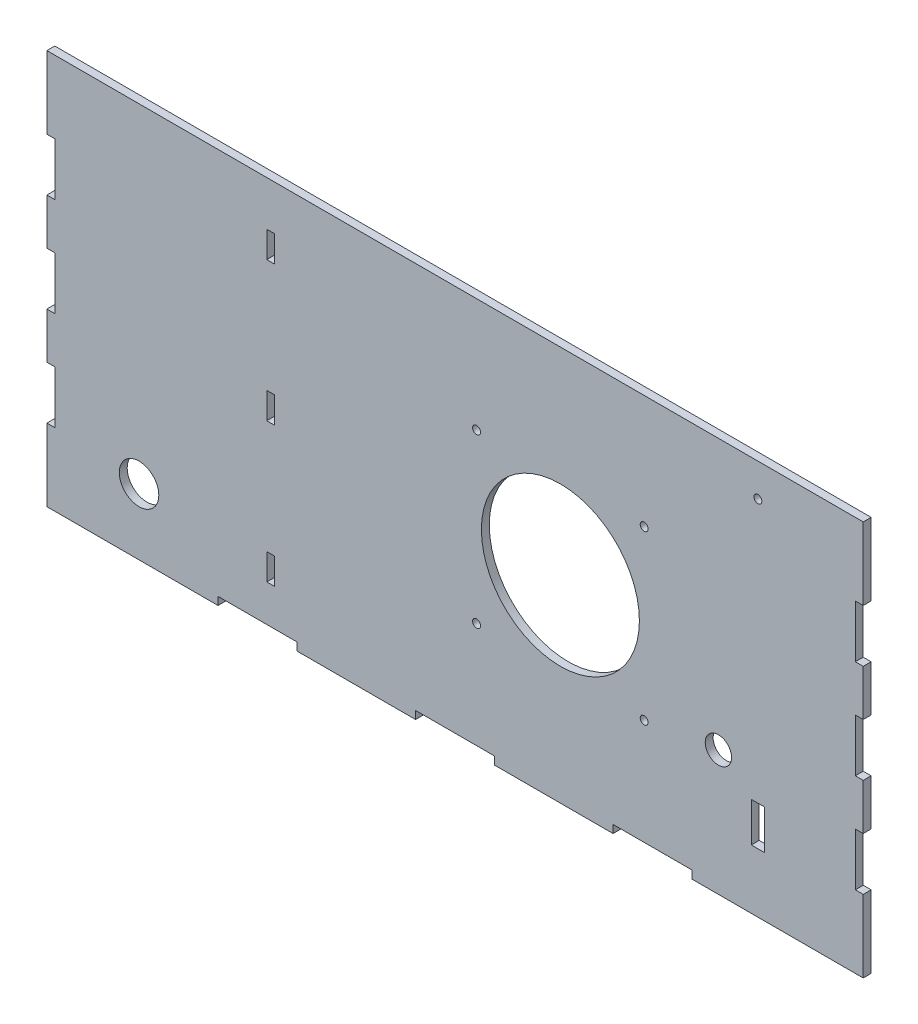
from build123d import *

# Parameters (mm, degrees)
ESQUISSE1_W              = 310
ESQUISSE1_H              = 150
BOSS_EXTRU_1_DEPTH       = 3
ESQUISSE3_R              = 30
ENL_V_MAT_EXTRU_2_DEPTH  = 10
ESQUISSE5_R              = 1.5
ENL_V_MAT_EXTRU_4_DEPTH  = 10
ESQUISSE6_R              = 7.5
ENL_V_MAT_EXTRU_5_DEPTH  = 10
ESQUISSE7_W              = 3
ESQUISSE7_H              = 10
ENL_V_MAT_EXTRU_6_DEPTH  = 10
ESQUISSE2_W              = 30
ESQUISSE2_H              = 6
ESQUISSE2_W_2            = 6
ESQUISSE2_H_2            = 20
ENL_V_MAT_EXTRU_7_DEPTH  = 10
ESQUISSE8_W              = 5
ESQUISSE8_H              = 15
ENL_V_MAT_EXTRU_8_DEPTH  = 10
ENL_V_MAT_EXTRU_9_DEPTH  = 1
ESQUISSE10_W             = 0.314102564
ESQUISSE10_H             = 3.5
ENL_V_MAT_EXTRU_10_DEPTH = 1
ENL_V_MAT_EXTRU_11_DEPTH = 1
ESQUISSE12_R             = 1.5
ESQUISSE12_R_2           = 5
ENL_V_MAT_EXTRU_12_DEPTH = 10
ENL_V_MAT_EXTRU_13_DEPTH = 1


with BuildPart() as part:
    # Esquisse1 → Boss.-Extru.1 (new body)
    with BuildSketch(Plane.XY):
        Rectangle(ESQUISSE1_W, ESQUISSE1_H)
    extrude(amount=BOSS_EXTRU_1_DEPTH)

    # Esquisse3 → Enlèv. mat.-Extru.2 (cut)
    with BuildSketch(Plane(origin=(0, 0, 0), x_dir=(-1, 0, 0), z_dir=(0, 0, -1))):
        with Locations((-40, 0)):
            Circle(ESQUISSE3_R)
    extrude(amount=-ENL_V_MAT_EXTRU_2_DEPTH, mode=Mode.SUBTRACT)

    # Esquisse5 → Enlèv. mat.-Extru.4 (cut)
    with BuildSketch(Plane(origin=(0, 0, 0), x_dir=(-1, 0, 0), z_dir=(0, 0, -1))):
        with Locations((-71.819805153, 31.819805153)):
            Circle(ESQUISSE5_R)
        with Locations((-71.819805153, -31.819805153)):
            Circle(ESQUISSE5_R)
        with Locations((-8.180194847, -31.819805153)):
            Circle(ESQUISSE5_R)
        with Locations((-8.180194847, 31.819805153)):
            Circle(ESQUISSE5_R)
    extrude(amount=-ENL_V_MAT_EXTRU_4_DEPTH, mode=Mode.SUBTRACT)

    # Esquisse6 → Enlèv. mat.-Extru.5 (cut)
    with BuildSketch(Plane(origin=(0, 0, 0), x_dir=(-1, 0, 0), z_dir=(0, 0, -1))):
        with Locations((120, -50)):
            Circle(ESQUISSE6_R)
    extrude(amount=-ENL_V_MAT_EXTRU_5_DEPTH, mode=Mode.SUBTRACT)

    # Esquisse7 → Enlèv. mat.-Extru.6 (cut)
    with BuildSketch(Plane(origin=(0, 0, 0), x_dir=(-1, 0, 0), z_dir=(0, 0, -1))):
        with Locations((70, 53)):
            Rectangle(ESQUISSE7_W, ESQUISSE7_H)
        with Locations((70, 0)):
            Rectangle(ESQUISSE7_W, ESQUISSE7_H)
        with Locations((70, -53)):
            Rectangle(ESQUISSE7_W, ESQUISSE7_H)
    extrude(amount=-ENL_V_MAT_EXTRU_6_DEPTH, mode=Mode.SUBTRACT)

    # Esquisse2 → Enlèv. mat.-Extru.7 (cut)
    with BuildSketch(Plane(origin=(0, 0, 0), x_dir=(-1, 0, 0), z_dir=(0, 0, -1))):
        with Locations((-75, -75)):
            Rectangle(ESQUISSE2_W, ESQUISSE2_H)
        with Locations((0, -75)):
            Rectangle(ESQUISSE2_W, ESQUISSE2_H)
        with Locations((75, -75)):
            Rectangle(ESQUISSE2_W, ESQUISSE2_H)
        with Locations((155, 37.5)):
            Rectangle(ESQUISSE2_W_2, ESQUISSE2_H_2)
        with Locations((155, 0)):
            Rectangle(ESQUISSE2_W_2, ESQUISSE2_H_2)
        with Locations((155, -37.5)):
            Rectangle(ESQUISSE2_W_2, ESQUISSE2_H_2)
        with Locations((-155, 37.5)):
            Rectangle(ESQUISSE2_W_2, ESQUISSE2_H_2)
        with Locations((-155, 0)):
            Rectangle(ESQUISSE2_W_2, ESQUISSE2_H_2)
        with Locations((-155, -37.5)):
            Rectangle(ESQUISSE2_W_2, ESQUISSE2_H_2)
    extrude(amount=-ENL_V_MAT_EXTRU_7_DEPTH, mode=Mode.SUBTRACT)

    # Esquisse8 → Enlèv. mat.-Extru.8 (cut)
    with BuildSketch(Plane(origin=(0, 0, 0), x_dir=(-1, 0, 0), z_dir=(0, 0, -1))):
        with Locations((-115, -45)):
            Rectangle(ESQUISSE8_W, ESQUISSE8_H)
    extrude(amount=-ENL_V_MAT_EXTRU_8_DEPTH, mode=Mode.SUBTRACT)

    # Esquisse9 → Enlèv. mat.-Extru.9 (cut)
    # profile 1 of 3: a face of its own
    with BuildSketch(Plane(origin=(0, 0, 0), x_dir=(-1, 0, 0), z_dir=(0, 0, -1))):
        with BuildLine():
            Line((-124, -40.641025641), (-124, -41.341446314))
            add(Edge.make_bspline(
                [(-124, -41.341446314), (-124.000155586, -41.388187443), (-124.000454328, -41.477935587), (-124.002120091, -41.606508857), (-124.006894447, -41.723335954), (-124.01100303, -41.828355794), (-124.018494972, -41.921566449), (-124.025655619, -42.003253739), (-124.03502928, -42.073041437), (-124.043734703, -42.115287288), (-124.047676282, -42.134415064)],
                knots=[0, 0, 0, 0, 1.410062039, 2.707475311, 3.878576406, 4.937260626, 5.877586885, 6.699081471, 7.410979367, 8, 8, 8, 8], degree=3))
            add(Edge.make_bspline(
                [(-124.047676282, -42.134415064), (-124.05400233, -42.160022139), (-124.066519473, -42.210690021), (-124.092989487, -42.283633544), (-124.123570695, -42.353172009), (-124.159768254, -42.41904446), (-124.200950797, -42.481257007), (-124.247358942, -42.539716501), (-124.299229026, -42.594088712), (-124.355236506, -42.644792009), (-124.415870063, -42.690752915), (-124.480246433, -42.730526066), (-124.547962977, -42.764583616), (-124.61925551, -42.791772782), (-124.69352137, -42.813645633), (-124.77140904, -42.829073285), (-124.852570327, -42.838324082), (-124.907928192, -42.839265991), (-124.935997596, -42.83974359)],
                knots=[0, 0, 0, 0, 1.02737288, 2.032829108, 3.019628684, 3.985738875, 4.958353778, 5.924249254, 6.890702889, 7.883913451, 8.865824512, 9.85161466, 10.829249435, 11.81541824, 12.821369441, 13.843154991, 14.906364023, 16, 16, 16, 16], degree=3))
            add(Edge.make_bspline(
                [(-124.935997596, -42.83974359), (-124.982632754, -42.83827463), (-125.073630027, -42.835408308), (-125.205690159, -42.808682672), (-125.328882215, -42.7649081), (-125.443034754, -42.704577636), (-125.545982774, -42.627784712), (-125.636099546, -42.53549708), (-125.712207266, -42.428186047), (-125.764423869, -42.327817492), (-125.79802227, -42.239115108), (-125.821780902, -42.165875438), (-125.839827879, -42.085922674), (-125.856230059, -42.00040386), (-125.868746241, -41.908658439), (-125.877635108, -41.810871165), (-125.883350718, -41.706797467), (-125.884185793, -41.635457705), (-125.884615385, -41.598758013)],
                knots=[0, 0, 0, 0, 1.260402266, 2.459371274, 3.627181936, 4.786749125, 5.93865593, 7.087644312, 8.261344208, 9.485713728, 10.136162886, 10.825977872, 11.566646758, 12.35154167, 13.181268117, 14.0701832, 15.007234106, 16, 16, 16, 16], degree=3))
            Line((-125.884615385, -41.598758013), (-127.5, -42.884615385))
            Line((-127.5, -42.884615385), (-127.5, -42.49619391))
            Line((-127.5, -42.49619391), (-125.884615385, -41.210336538))
            Line((-125.884615385, -41.210336538), (-125.884615385, -40.955128205))
            Line((-125.884615385, -40.955128205), (-127.5, -40.955128205))
            Line((-127.5, -40.955128205), (-127.5, -40.641025641))
            Line((-127.5, -40.641025641), (-124, -40.641025641))
        make_face()
        with BuildLine():
            Line((-124.358974359, -40.955128205), (-125.525641026, -40.955128205))
            Line((-125.525641026, -40.955128205), (-125.530548878, -41.595953526))
            add(Edge.make_bspline(
                [(-125.530548878, -41.595953526), (-125.530562115, -41.625873564), (-125.530587771, -41.683867121), (-125.526593996, -41.767767788), (-125.522050673, -41.845887894), (-125.515101343, -41.917928665), (-125.506145223, -41.983922178), (-125.494942396, -42.043835796), (-125.48188982, -42.09776618), (-125.461690357, -42.160667531), (-125.429669718, -42.230885047), (-125.383161564, -42.30729109), (-125.324285939, -42.372136263), (-125.258032574, -42.428045371), (-125.183690187, -42.471109624), (-125.104558557, -42.502452844), (-125.021320853, -42.522122461), (-124.96414901, -42.524460901), (-124.935296474, -42.525641026)],
                knots=[0, 0, 0, 0, 1.14660753, 2.222451964, 3.218720504, 4.145691244, 4.995719623, 5.770487122, 6.480909919, 7.121111896, 8.299844659, 9.430703709, 10.534634535, 11.641396424, 12.741395289, 13.810956493, 14.895269934, 16, 16, 16, 16], degree=3))
            add(Edge.make_bspline(
                [(-124.935296474, -42.525641026), (-124.907142095, -42.524457273), (-124.851350389, -42.522111508), (-124.769896953, -42.502414733), (-124.692470091, -42.470607322), (-124.620545612, -42.42600597), (-124.55471362, -42.372112077), (-124.499164703, -42.308105065), (-124.452645723, -42.237208406), (-124.423135579, -42.170898184), (-124.405007029, -42.111670028), (-124.392265865, -42.060237921), (-124.381943017, -42.001903151), (-124.373917197, -41.93680552), (-124.366694876, -41.865062799), (-124.362012115, -41.786478543), (-124.359181853, -41.7011435), (-124.359045133, -41.641996318), (-124.358974359, -41.611378205)],
                knots=[0, 0, 0, 0, 1.100801541, 2.181386982, 3.260112282, 4.364594493, 5.481957178, 6.577424609, 7.668452592, 8.790448866, 9.403819393, 10.091598921, 10.863153553, 11.720938239, 12.658472417, 13.685008818, 14.801622349, 16, 16, 16, 16], degree=3))
            Line((-124.358974359, -41.611378205), (-124.358974359, -40.955128205))
        make_face(mode=Mode.SUBTRACT)
    # profile 2 of 3: a face of its own
    with BuildSketch(Plane(origin=(0, 0, 0), x_dir=(-1, 0, 0), z_dir=(0, 0, -1))):
        with BuildLine():
            Line((-124.597355769, -46.878205128), (-124.852564103, -46.608974359))
            add(Edge.make_bspline(
                [(-124.852564103, -46.608974359), (-124.806811581, -46.559960399), (-124.716640423, -46.463361447), (-124.598152528, -46.306894721), (-124.498431764, -46.142766504), (-124.415881976, -45.973417967), (-124.350612698, -45.801872224), (-124.304393861, -45.630880804), (-124.274460152, -45.462289835), (-124.270959352, -45.35034626), (-124.269230769, -45.295072115)],
                knots=[0, 0, 0, 0, 1.09204548, 2.152253107, 3.191356492, 4.216655925, 5.218178745, 6.177092199, 7.099906635, 8, 8, 8, 8], degree=3))
            add(Edge.make_bspline(
                [(-124.269230769, -45.295072115), (-124.269644986, -45.261157606), (-124.270472345, -45.193416545), (-124.28100747, -45.092791768), (-124.29620646, -44.993235767), (-124.317971559, -44.895091856), (-124.346240743, -44.79796983), (-124.380371562, -44.70208574), (-124.421457804, -44.607624668), (-124.46829982, -44.515083454), (-124.51943581, -44.42491077), (-124.576466766, -44.340101822), (-124.637641339, -44.260307922), (-124.7037483, -44.186075131), (-124.773736987, -44.116454001), (-124.8485597, -44.052349106), (-124.927673356, -43.993438911), (-125.011070646, -43.940402271), (-125.096855791, -43.893047282), (-125.184246294, -43.851160039), (-125.273151073, -43.816340055), (-125.36305518, -43.787444752), (-125.454146065, -43.764807328), (-125.546426111, -43.748611724), (-125.640210305, -43.739545576), (-125.703006689, -43.737971033), (-125.734575321, -43.737179487)],
                knots=[0, 0, 0, 0, 1.028345126, 2.054023193, 3.065714254, 4.082262095, 5.100859654, 6.132352297, 7.167492809, 8.223256921, 9.277568108, 10.309840045, 11.320860232, 12.32524711, 13.322830633, 14.313234294, 15.3114222, 16.312425732, 17.308799391, 18.282312954, 19.249923241, 20.202773571, 21.145015718, 22.094907699, 23.042283124, 24, 24, 24, 24], degree=3))
            add(Edge.make_bspline(
                [(-125.734575321, -43.737179487), (-125.766844336, -43.737941939), (-125.831294251, -43.739464762), (-125.927515229, -43.749024522), (-126.022122671, -43.76732269), (-126.116169088, -43.789863232), (-126.208436097, -43.821256824), (-126.299956916, -43.858271451), (-126.389894262, -43.902642799), (-126.477700969, -43.95385026), (-126.56322153, -44.010044343), (-126.643781709, -44.072985324), (-126.720450311, -44.139846467), (-126.791526121, -44.213060217), (-126.858910005, -44.2902798), (-126.92074553, -44.373812065), (-126.978223753, -44.462014529), (-127.030620272, -44.55502174), (-127.077428808, -44.651824522), (-127.119052704, -44.751081275), (-127.153332041, -44.853109091), (-127.181270145, -44.957371781), (-127.204170443, -45.063745052), (-127.218902923, -45.172768855), (-127.229593754, -45.283641563), (-127.230375424, -45.358380196), (-127.230769231, -45.396033654)],
                knots=[0, 0, 0, 0, 0.935842715, 1.869129955, 2.799583258, 3.728257868, 4.6712142, 5.62263184, 6.589468525, 7.576334199, 8.568768874, 9.554260682, 10.538610026, 11.516240982, 12.510802173, 13.508383516, 14.52719334, 15.561971611, 16.601598616, 17.64369662, 18.68095744, 19.719943675, 20.77263142, 21.833597991, 22.908562741, 24, 24, 24, 24], degree=3))
            add(Edge.make_bspline(
                [(-127.230769231, -45.396033654), (-127.229820655, -45.441412001), (-127.227957971, -45.530519759), (-127.21345768, -45.661506199), (-127.190810892, -45.787309279), (-127.157644974, -45.907575448), (-127.115341378, -46.022444595), (-127.064345702, -46.132337072), (-127.00270372, -46.236390458), (-126.933125824, -46.33490717), (-126.855625749, -46.425688024), (-126.771928179, -46.507456959), (-126.682852009, -46.579330438), (-126.587610464, -46.640710598), (-126.487726527, -46.693589206), (-126.381421462, -46.735757586), (-126.269900532, -46.768376013), (-126.192802538, -46.781719359), (-126.153846154, -46.788461538)],
                knots=[0, 0, 0, 0, 1.13011591, 2.219166196, 3.278784489, 4.311187005, 5.322345388, 6.325022048, 7.324448642, 8.33076908, 9.325913853, 10.293360401, 11.241630175, 12.171712957, 13.111744789, 14.052245185, 15.015830637, 16, 16, 16, 16], degree=3))
            Line((-126.153846154, -46.788461538), (-126.153846154, -45.621794872))
            Line((-126.153846154, -45.621794872), (-125.794871795, -45.621794872))
            Line((-125.794871795, -45.621794872), (-125.794871795, -47.102564103))
            add(Edge.make_bspline(
                [(-125.794871795, -47.102564103), (-125.861779284, -47.100858254), (-125.992729325, -47.097519601), (-126.183699596, -47.074100685), (-126.36407129, -47.036284173), (-126.534034361, -46.984623861), (-126.693347954, -46.917748581), (-126.84217382, -46.836376052), (-126.979550501, -46.739203931), (-127.106599505, -46.62969349), (-127.219928717, -46.506793532), (-127.319534655, -46.373824912), (-127.40343727, -46.230567944), (-127.471697933, -46.077158136), (-127.524971927, -45.914097703), (-127.562743504, -45.741009323), (-127.585373467, -45.558127722), (-127.588264847, -45.432791045), (-127.58974359, -45.368689904)],
                knots=[0, 0, 0, 0, 1.140356446, 2.231883559, 3.274166699, 4.278491846, 5.25512956, 6.21435461, 7.1637429, 8.11826594, 9.068280886, 10.0076534, 10.945064095, 11.891975133, 12.864533718, 13.863980011, 14.907571808, 16, 16, 16, 16], degree=3))
            add(Edge.make_bspline(
                [(-127.58974359, -45.368689904), (-127.589174469, -45.329179768), (-127.588051978, -45.251253048), (-127.580074631, -45.13616212), (-127.567794054, -45.024244499), (-127.549248931, -44.91551649), (-127.526534277, -44.809578148), (-127.497447558, -44.706958563), (-127.463778859, -44.607266821), (-127.425483185, -44.510348835), (-127.381111528, -44.417084289), (-127.331801889, -44.327057772), (-127.277808528, -44.239771646), (-127.218197682, -44.155820481), (-127.153415222, -44.074766859), (-127.083331303, -43.997133416), (-127.008160184, -43.922485538), (-126.954781174, -43.875725074), (-126.927884615, -43.852163462)],
                knots=[0, 0, 0, 0, 1.107784379, 2.184907829, 3.233506516, 4.263428166, 5.276301166, 6.270063455, 7.25232949, 8.225834625, 9.190232166, 10.146266622, 11.1027726, 12.066435141, 13.031522626, 14.010570082, 14.99756817, 16, 16, 16, 16], degree=3))
            add(Edge.make_bspline(
                [(-126.927884615, -43.852163462), (-126.885213962, -43.81797753), (-126.800580945, -43.750173117), (-126.664981001, -43.66289496), (-126.524579141, -43.588493558), (-126.378984512, -43.528125735), (-126.228333299, -43.480987649), (-126.072818008, -43.447181396), (-125.912238378, -43.427374107), (-125.803573113, -43.42452057), (-125.748597756, -43.423076923)],
                knots=[0, 0, 0, 0, 1.023165419, 2.029347347, 3.013907458, 3.994755782, 4.975994455, 5.96558838, 6.970761222, 8, 8, 8, 8], degree=3))
            add(Edge.make_bspline(
                [(-125.748597756, -43.423076923), (-125.707431937, -43.423610603), (-125.625623489, -43.424671181), (-125.504159814, -43.437475481), (-125.384882944, -43.455956263), (-125.267682407, -43.482724935), (-125.153078645, -43.517945905), (-125.040190591, -43.560244544), (-124.929471181, -43.609789749), (-124.821895222, -43.667601651), (-124.71752396, -43.73054957), (-124.619552768, -43.801258168), (-124.526286659, -43.876245679), (-124.439415031, -43.957632214), (-124.358559575, -44.044956717), (-124.28342071, -44.137735662), (-124.213806388, -44.235923709), (-124.150837678, -44.339861329), (-124.094273753, -44.447988623), (-124.044684623, -44.560048729), (-124.003701285, -44.676006812), (-123.968927512, -44.794994297), (-123.943212369, -44.917911796), (-123.924563624, -45.043867333), (-123.911803025, -45.173517445), (-123.910776769, -45.261153474), (-123.91025641, -45.305588942)],
                knots=[0, 0, 0, 0, 1.009014138, 2.005204323, 2.991638015, 3.967544938, 4.950092358, 5.929358695, 6.922031709, 7.921874511, 8.922406847, 9.908357674, 10.882125353, 11.855201406, 12.82437151, 13.798139189, 14.780770167, 15.773426639, 16.775664355, 17.771244468, 18.775446331, 19.789330884, 20.808771541, 21.851841802, 22.910785716, 24, 24, 24, 24], degree=3))
            add(Edge.make_bspline(
                [(-123.91025641, -45.305588942), (-123.910834454, -45.341827451), (-123.911980646, -45.413684155), (-123.919966489, -45.520606008), (-123.932483695, -45.62566469), (-123.949986912, -45.729387217), (-123.97314083, -45.831378655), (-124.001358756, -45.931948008), (-124.034029662, -46.030905064), (-124.073024128, -46.128132099), (-124.117276221, -46.224290146), (-124.167090065, -46.319911895), (-124.223314952, -46.414671167), (-124.28611852, -46.508732141), (-124.354421929, -46.602688001), (-124.430178755, -46.695052643), (-124.510401511, -46.788055587), (-124.568083695, -46.847857401), (-124.597355769, -46.878205128)],
                knots=[0, 0, 0, 0, 0.985875312, 1.954874891, 2.915472732, 3.863573565, 4.815313299, 5.759461513, 6.704487138, 7.649063459, 8.607849844, 9.583336382, 10.581114205, 11.603942397, 12.659508253, 13.739925933, 14.853076422, 16, 16, 16, 16], degree=3))
        make_face()
    # profile 3 of 3: a face of its own
    with BuildSketch(Plane(origin=(0, 0, 0), x_dir=(-1, 0, 0), z_dir=(0, 0, -1))):
        with BuildLine():
            Line((-124, -47.820512821), (-124, -48.503405449))
            add(Edge.make_bspline(
                [(-124, -48.503405449), (-124.00017575, -48.536833927), (-124.000516398, -48.601626637), (-124.00579953, -48.695846079), (-124.013003199, -48.78409489), (-124.024433292, -48.866398662), (-124.038225069, -48.942719364), (-124.054926885, -49.013287002), (-124.074953499, -49.077877174), (-124.10679978, -49.15498991), (-124.154122949, -49.242910571), (-124.224051514, -49.338108964), (-124.309583977, -49.419513203), (-124.406066632, -49.489699521), (-124.512202404, -49.54550064), (-124.625461593, -49.585869937), (-124.744383335, -49.611427813), (-124.826026513, -49.614056247), (-124.86728766, -49.615384615)],
                knots=[0, 0, 0, 0, 1.001505555, 1.941167018, 2.826882275, 3.653841531, 4.429895133, 5.150066043, 5.825578002, 6.45369114, 7.647487171, 8.808567382, 9.977351308, 11.170798116, 12.373658725, 13.556498008, 14.765093433, 16, 16, 16, 16], degree=3))
            add(Edge.make_bspline(
                [(-124.86728766, -49.615384615), (-124.905946765, -49.614312526), (-124.981915552, -49.612205768), (-125.092849321, -49.591374116), (-125.198883872, -49.560358757), (-125.298712019, -49.51533362), (-125.391050753, -49.457417361), (-125.47535131, -49.387721827), (-125.549570736, -49.304740184), (-125.590890459, -49.242468522), (-125.611879006, -49.21083734)],
                knots=[0, 0, 0, 0, 1.044266239, 2.052081639, 3.041743201, 4.026043445, 5.00270663, 5.980942822, 6.97441044, 8, 8, 8, 8], degree=3))
            add(Edge.make_bspline(
                [(-125.611879006, -49.21083734), (-125.627132225, -49.250604426), (-125.656315412, -49.326688714), (-125.708191681, -49.431466029), (-125.763978951, -49.522100731), (-125.825223894, -49.598692584), (-125.892064968, -49.663209367), (-125.963163716, -49.721146777), (-126.04202043, -49.769685337), (-126.12638972, -49.811384051), (-126.215679439, -49.844200502), (-126.309481233, -49.867420295), (-126.406746226, -49.881687727), (-126.473042202, -49.883633234), (-126.506510417, -49.884615385)],
                knots=[0, 0, 0, 0, 1.272302504, 2.434229863, 3.488457646, 4.447234501, 5.35599188, 6.26022912, 7.18267843, 8.11661068, 9.06895546, 10.019249207, 11.000057067, 12, 12, 12, 12], degree=3))
            add(Edge.make_bspline(
                [(-126.506510417, -49.884615385), (-126.540677095, -49.883638232), (-126.607900992, -49.881715657), (-126.706658894, -49.867540064), (-126.801023671, -49.843514864), (-126.89166627, -49.810502927), (-126.978073623, -49.767173394), (-127.061327909, -49.715579211), (-127.13921129, -49.652782552), (-127.213575919, -49.582786786), (-127.280399292, -49.503509052), (-127.339890648, -49.417986991), (-127.389040637, -49.324990517), (-127.429811754, -49.225961758), (-127.461409161, -49.120242664), (-127.483345547, -49.008225217), (-127.498160727, -48.889885075), (-127.499376506, -48.808674739), (-127.5, -48.767027244)],
                knots=[0, 0, 0, 0, 0.978404568, 1.925038397, 2.85041836, 3.763147166, 4.682162379, 5.614488577, 6.562659439, 7.54271123, 8.535210642, 9.526693784, 10.520907202, 11.541451354, 12.589717429, 13.675358278, 14.807842563, 16, 16, 16, 16], degree=3))
            Line((-127.5, -48.767027244), (-127.5, -47.820512821))
            Line((-127.5, -47.820512821), (-124, -47.820512821))
        make_face()
        with BuildLine():
            Line((-124.358974359, -48.134615385), (-125.480769231, -48.134615385))
            Line((-125.480769231, -48.134615385), (-125.480769231, -48.345653045))
            add(Edge.make_bspline(
                [(-125.480769231, -48.345653045), (-125.480372636, -48.376502118), (-125.479606333, -48.436108814), (-125.477342055, -48.522658105), (-125.471279617, -48.602795424), (-125.464867589, -48.676796909), (-125.454994379, -48.74416657), (-125.442912342, -48.805129943), (-125.430246191, -48.86023467), (-125.408644988, -48.923753638), (-125.377044357, -48.995783306), (-125.326849577, -49.07208162), (-125.268687991, -49.140436884), (-125.200339426, -49.197512668), (-125.125717935, -49.244610166), (-125.044816866, -49.276040993), (-124.960794569, -49.298334465), (-124.902961099, -49.300289458), (-124.873597756, -49.301282051)],
                knots=[0, 0, 0, 0, 1.156481963, 2.23455883, 3.244418989, 4.168404366, 5.01828131, 5.794834307, 6.498111525, 7.13526334, 8.307595709, 9.435046769, 10.546766856, 11.659452936, 12.760769924, 13.837671619, 14.902137667, 16, 16, 16, 16], degree=3))
            add(Edge.make_bspline(
                [(-124.873597756, -49.301282051), (-124.854162836, -49.300785614), (-124.816039116, -49.299811797), (-124.760677584, -49.290948906), (-124.707943771, -49.278088766), (-124.65905052, -49.257997304), (-124.612608143, -49.233702574), (-124.570679458, -49.202099538), (-124.530967362, -49.166408996), (-124.494929985, -49.124493927), (-124.462640353, -49.076557289), (-124.43422831, -49.022142332), (-124.411816077, -48.960599313), (-124.391711112, -48.893323652), (-124.377760457, -48.819238661), (-124.366095851, -48.739068251), (-124.36016641, -48.652132313), (-124.359380572, -48.591987386), (-124.358974359, -48.560897436)],
                knots=[0, 0, 0, 0, 0.911752476, 1.788502045, 2.626783689, 3.45400582, 4.26402138, 5.080402872, 5.911472738, 6.767166405, 7.66795952, 8.620018292, 9.640966946, 10.73819047, 11.913090943, 13.176185384, 14.540321519, 16, 16, 16, 16], degree=3))
            Line((-124.358974359, -48.560897436), (-124.358974359, -48.134615385))
        make_face(mode=Mode.SUBTRACT)
        with BuildLine():
            Line((-125.83974359, -48.134615385), (-127.141025641, -48.134615385))
            Line((-127.141025641, -48.134615385), (-127.141025641, -48.58193109))
            add(Edge.make_bspline(
                [(-127.141025641, -48.58193109), (-127.140643234, -48.613950174), (-127.139906195, -48.675662739), (-127.137473801, -48.764761856), (-127.132057221, -48.847120224), (-127.123226752, -48.922785235), (-127.114051125, -48.992422946), (-127.101351613, -49.055341507), (-127.086913804, -49.111637374), (-127.06457061, -49.176905565), (-127.029919312, -49.250448931), (-126.977332258, -49.329647731), (-126.915507839, -49.400765003), (-126.843051896, -49.460464391), (-126.764864915, -49.509761804), (-126.68135584, -49.544336956), (-126.595072284, -49.566568284), (-126.536090467, -49.569195328), (-126.506510417, -49.570512821)],
                knots=[0, 0, 0, 0, 1.159821618, 2.235403267, 3.228114831, 4.14795534, 4.994323282, 5.771256229, 6.471395042, 7.097801288, 8.267864287, 9.404187171, 10.531774336, 11.667624178, 12.792825787, 13.866573821, 14.930062559, 16, 16, 16, 16], degree=3))
            add(Edge.make_bspline(
                [(-126.506510417, -49.570512821), (-126.488014684, -49.570243529), (-126.451321555, -49.56970929), (-126.397440618, -49.561349349), (-126.345015027, -49.549686686), (-126.294837535, -49.532798147), (-126.246091647, -49.511503068), (-126.19962644, -49.484778552), (-126.154330913, -49.453916799), (-126.097132928, -49.405638819), (-126.031208702, -49.335483929), (-125.966673611, -49.235771437), (-125.914625123, -49.122400754), (-125.892525744, -49.040173031), (-125.881109776, -48.997696314)],
                knots=[0, 0, 0, 0, 0.723503378, 1.435336582, 2.130201219, 2.824764462, 3.504949994, 4.209866579, 4.920640069, 5.648298893, 7.13757748, 8.670694625, 10.280166878, 12, 12, 12, 12], degree=3))
            add(Edge.make_bspline(
                [(-125.881109776, -48.997696314), (-125.877654459, -48.980667234), (-125.870162621, -48.943744676), (-125.862259384, -48.88353679), (-125.855169923, -48.814570437), (-125.85006353, -48.737140391), (-125.844581907, -48.650938703), (-125.842525963, -48.555993067), (-125.840016576, -48.452236359), (-125.839836913, -48.380243898), (-125.83974359, -48.342848558)],
                knots=[0, 0, 0, 0, 0.634452549, 1.375623993, 2.216454381, 3.166361212, 4.209414599, 5.370755378, 6.634280627, 8, 8, 8, 8], degree=3))
            Line((-125.83974359, -48.342848558), (-125.83974359, -48.134615385))
        make_face(mode=Mode.SUBTRACT)
    extrude(amount=-ENL_V_MAT_EXTRU_9_DEPTH, mode=Mode.SUBTRACT)

    # Esquisse10 → Enlèv. mat.-Extru.10 (cut)
    # profile 1 of 16: a face of its own
    with BuildSketch(Plane(origin=(0, 0, 0), x_dir=(-1, 0, 0), z_dir=(0, 0, -1))):
        Polygon((-64.640317974, 42.319805153), (-62.935189769, 42.319805153), (-62.935189769, 41.960830794), (-64.32621541, 41.960830794), (-64.32621541, 40.883907717), (-62.935189769, 40.883907717), (-62.935189769, 40.524933359), (-64.32621541, 40.524933359), (-64.32621541, 38.819805153), (-64.640317974, 38.819805153), align=None)
    # profile 2 of 16: a face of its own
    with BuildSketch(Plane(origin=(0, 0, 0), x_dir=(-1, 0, 0), z_dir=(0, 0, -1))):
        Polygon((-62.306984641, 42.319805153), (-60.332625666, 42.319805153), (-60.332625666, 41.960830794), (-61.992882076, 41.960830794), (-61.992882076, 40.883907717), (-60.332625666, 40.883907717), (-60.332625666, 40.524933359), (-61.992882076, 40.524933359), (-61.992882076, 39.178779512), (-60.332625666, 39.178779512), (-60.332625666, 38.819805153), (-62.306984641, 38.819805153), align=None)
    # profile 3 of 16: a face of its own
    with BuildSketch(Plane(origin=(0, 0, 0), x_dir=(-1, 0, 0), z_dir=(0, 0, -1))):
        Polygon((-59.704420538, 42.319805153), (-57.730061564, 42.319805153), (-57.730061564, 41.960830794), (-59.390317974, 41.960830794), (-59.390317974, 40.883907717), (-57.730061564, 40.883907717), (-57.730061564, 40.524933359), (-59.390317974, 40.524933359), (-59.390317974, 39.178779512), (-57.730061564, 39.178779512), (-57.730061564, 38.819805153), (-59.704420538, 38.819805153), align=None)
    # profile 4 of 16: a face of its own
    with BuildSketch(Plane(origin=(0, 0, 0), x_dir=(-1, 0, 0), z_dir=(0, 0, -1))):
        with BuildLine():
            Line((-57.101856435, 38.819805153), (-57.101856435, 42.319805153))
            Line((-57.101856435, 42.319805153), (-56.395125666, 42.319805153))
            add(Edge.make_bspline(
                [(-56.395125666, 42.319805153), (-56.333656678, 42.319362583), (-56.214898913, 42.31850754), (-56.043286465, 42.313086149), (-55.884502703, 42.303495683), (-55.739069844, 42.289526157), (-55.606588632, 42.272373124), (-55.487430024, 42.250872719), (-55.380977881, 42.225484549), (-55.31550844, 42.203839099), (-55.284548743, 42.19360323)],
                knots=[0, 0, 0, 0, 1.314313732, 2.53924729, 3.670748893, 4.714932338, 5.66265055, 6.526160246, 7.303039223, 8, 8, 8, 8], degree=3))
            add(Edge.make_bspline(
                [(-55.284548743, 42.19360323), (-55.244054004, 42.178172525), (-55.163982812, 42.147661031), (-55.049975689, 42.090104729), (-54.942650326, 42.024891628), (-54.841431181, 41.951935765), (-54.748630355, 41.869171416), (-54.660622458, 41.780114331), (-54.581007734, 41.68152599), (-54.508099438, 41.575451003), (-54.442363779, 41.46313895), (-54.385224621, 41.344803842), (-54.337770628, 41.221046634), (-54.298377401, 41.092211486), (-54.267330943, 40.958015108), (-54.246149012, 40.818301242), (-54.232178022, 40.673622052), (-54.23077397, 40.575447589), (-54.230061564, 40.52563448)],
                knots=[0, 0, 0, 0, 0.984719456, 1.947108742, 2.898477687, 3.838006223, 4.779231079, 5.722358779, 6.681677486, 7.655904652, 8.64651281, 9.637519902, 10.640069247, 11.656948941, 12.698408672, 13.768548281, 14.867775369, 16, 16, 16, 16], degree=3))
            add(Edge.make_bspline(
                [(-54.230061564, 40.52563448), (-54.230690531, 40.482373242), (-54.231929977, 40.397122453), (-54.243059293, 40.271481557), (-54.259235613, 40.149567986), (-54.284279811, 40.031962286), (-54.314682324, 39.917634068), (-54.353646476, 39.807801824), (-54.398281972, 39.701458014), (-54.45033185, 39.600040538), (-54.507473235, 39.503957166), (-54.568794979, 39.413381638), (-54.634231674, 39.329606416), (-54.704407307, 39.252377804), (-54.778415023, 39.181812226), (-54.856739354, 39.11732021), (-54.939582405, 39.060163656), (-55.026573128, 39.008096547), (-55.120249257, 38.962676192), (-55.222385123, 38.924246182), (-55.333416301, 38.892399567), (-55.453070258, 38.865828671), (-55.581553736, 38.844751368), (-55.718992701, 38.830624976), (-55.865175991, 38.821072043), (-55.965555256, 38.82023565), (-56.017221019, 38.819805153)],
                knots=[0, 0, 0, 0, 1.105936401, 2.179363191, 3.223086493, 4.248585256, 5.251745608, 6.245858792, 7.225916811, 8.198733463, 9.158002045, 10.082870192, 10.993790845, 11.873723703, 12.748670949, 13.606408763, 14.465103618, 15.319838547, 16.196477973, 17.123216899, 18.106603292, 19.147568657, 20.255746949, 21.433717677, 22.679120308, 24, 24, 24, 24], degree=3))
            Line((-56.017221019, 38.819805153), (-57.101856435, 38.819805153))
        make_face()
        with BuildLine():
            Line((-56.787753871, 39.178779512), (-56.386011083, 39.178779512))
            add(Edge.make_bspline(
                [(-56.386011083, 39.178779512), (-56.328282712, 39.179027609), (-56.217249914, 39.179504789), (-56.057591916, 39.183691992), (-55.91171252, 39.19053393), (-55.779591011, 39.200109007), (-55.661301986, 39.212777623), (-55.556598236, 39.226902525), (-55.465822978, 39.244499976), (-55.410893541, 39.260450935), (-55.385510282, 39.26782198)],
                knots=[0, 0, 0, 0, 1.375205317, 2.645023457, 3.804390687, 4.853969522, 5.800190428, 6.637939096, 7.370582563, 8, 8, 8, 8], degree=3))
            add(Edge.make_bspline(
                [(-55.385510282, 39.26782198), (-55.35356192, 39.279073539), (-55.290428281, 39.301307912), (-55.199547196, 39.341865573), (-55.114790191, 39.389907643), (-55.034680166, 39.443309917), (-54.960353511, 39.503955919), (-54.890929394, 39.570526908), (-54.826547593, 39.643361683), (-54.767873285, 39.722369844), (-54.715364981, 39.80705964), (-54.669893752, 39.896598473), (-54.63004222, 39.990005284), (-54.598763627, 40.088714442), (-54.574248043, 40.191843501), (-54.556883355, 40.299399714), (-54.546068631, 40.411362996), (-54.544807183, 40.48751512), (-54.544164128, 40.526335602)],
                knots=[0, 0, 0, 0, 0.998632004, 1.973411704, 2.929992603, 3.868527914, 4.809262121, 5.754881198, 6.702106254, 7.672490631, 8.653608572, 9.636854334, 10.631411391, 11.644891563, 12.686317036, 13.754757253, 14.855430412, 16, 16, 16, 16], degree=3))
            add(Edge.make_bspline(
                [(-54.544164128, 40.526335602), (-54.544677415, 40.567269082), (-54.545685773, 40.647683267), (-54.558360083, 40.765673962), (-54.576881639, 40.879154613), (-54.603665325, 40.988132808), (-54.637796203, 41.09282116), (-54.680390845, 41.19264067), (-54.729057465, 41.288645539), (-54.786960801, 41.378619905), (-54.850376395, 41.463713014), (-54.920754274, 41.54166793), (-54.996976313, 41.61266223), (-55.078211162, 41.677801543), (-55.166748261, 41.734465218), (-55.260501952, 41.7851519), (-55.360847623, 41.828167791), (-55.430660319, 41.851046654), (-55.466139288, 41.862673743)],
                knots=[0, 0, 0, 0, 1.122418816, 2.205001699, 3.251619955, 4.274784885, 5.280384055, 6.268708349, 7.249350384, 8.229342522, 9.199999885, 10.157847722, 11.105861043, 12.055065948, 13.010012805, 13.98527497, 14.976112212, 16, 16, 16, 16], degree=3))
            add(Edge.make_bspline(
                [(-55.466139288, 41.862673743), (-55.495490434, 41.870790171), (-55.557899025, 41.888047924), (-55.659738489, 41.906873296), (-55.774353638, 41.923477795), (-55.902253339, 41.937535834), (-56.043291798, 41.947623156), (-56.197577486, 41.95519447), (-56.365177091, 41.960301103), (-56.481359625, 41.96064981), (-56.541660121, 41.960830794)],
                knots=[0, 0, 0, 0, 0.674548936, 1.434276114, 2.292660221, 3.240891867, 4.284742987, 5.42552168, 6.663806718, 8, 8, 8, 8], degree=3))
            Line((-56.541660121, 41.960830794), (-56.787753871, 41.960830794))
            Line((-56.787753871, 41.960830794), (-56.787753871, 39.178779512))
        make_face(mode=Mode.SUBTRACT)
    # profile 5 of 16: a face of its own
    with BuildSketch(Plane(origin=(0, 0, 0), x_dir=(-1, 0, 0), z_dir=(0, 0, -1))):
        with Locations((-53.355061564, 40.569805153)):
            Rectangle(ESQUISSE10_W, ESQUISSE10_H)
    # profile 6 of 16: a face of its own
    with BuildSketch(Plane(origin=(0, 0, 0), x_dir=(-1, 0, 0), z_dir=(0, 0, -1))):
        Polygon((-52.300574384, 38.819805153), (-52.300574384, 42.319805153), (-52.234668935, 42.319805153), (-49.922369256, 39.565097621), (-49.922369256, 42.319805153), (-49.608266692, 42.319805153), (-49.608266692, 38.819805153), (-49.679781115, 38.819805153), (-51.98647182, 41.568202589), (-51.98647182, 38.819805153), align=None)
    # profile 7 of 16: a face of its own
    with BuildSketch(Plane(origin=(0, 0, 0), x_dir=(-1, 0, 0), z_dir=(0, 0, -1))):
        with BuildLine():
            Line((-45.435189769, 41.722449384), (-45.704420538, 41.467241051))
            add(Edge.make_bspline(
                [(-45.704420538, 41.467241051), (-45.753139426, 41.513071914), (-45.849415473, 41.603640777), (-46.006375715, 41.721151772), (-46.170139349, 41.821817872), (-46.339851846, 41.903724108), (-46.5113104, 41.969076869), (-46.682239176, 42.015605009), (-46.850884878, 42.045277547), (-46.963052096, 42.048825916), (-47.018322782, 42.050574384)],
                knots=[0, 0, 0, 0, 1.08915593, 2.152340314, 3.188132944, 4.216796309, 5.218260357, 6.173443236, 7.099959455, 8, 8, 8, 8], degree=3))
            add(Edge.make_bspline(
                [(-47.018322782, 42.050574384), (-47.052237482, 42.050160778), (-47.119978922, 42.049334639), (-47.220600866, 42.038790424), (-47.320167503, 42.02362556), (-47.418490878, 42.001683682), (-47.515762164, 41.973874623), (-47.611643057, 41.939089159), (-47.706312411, 41.898533915), (-47.798878492, 41.851671441), (-47.888618996, 41.800191595), (-47.973375832, 41.743143054), (-48.05368923, 41.682354265), (-48.128049656, 41.616303285), (-48.196884842, 41.54558842), (-48.261833214, 41.471525114), (-48.32061051, 41.392089895), (-48.373701675, 41.308744269), (-48.421063294, 41.22295208), (-48.462871947, 41.13553909), (-48.497969035, 41.046795236), (-48.525738491, 40.956609158), (-48.548649144, 40.865678568), (-48.564766752, 40.773373848), (-48.573853474, 40.679596162), (-48.575425254, 40.616798904), (-48.57621541, 40.585229833)],
                knots=[0, 0, 0, 0, 1.02818874, 2.053710826, 3.065248034, 4.081641283, 5.106893873, 6.131558223, 7.173050175, 8.228653731, 9.27666206, 10.308777013, 11.325269123, 12.329503258, 13.32196095, 14.316845687, 15.314881793, 16.315733098, 17.311955233, 18.285320748, 19.252783886, 20.203351036, 21.145449891, 22.095197417, 23.042428769, 24, 24, 24, 24], degree=3))
            add(Edge.make_bspline(
                [(-48.57621541, 40.585229833), (-48.575459692, 40.552959016), (-48.573950319, 40.488505502), (-48.564289999, 40.392311429), (-48.546361759, 40.297546027), (-48.52239405, 40.203897894), (-48.492413234, 40.111206646), (-48.455040568, 40.019874136), (-48.410774967, 39.929903745), (-48.359538415, 39.842106128), (-48.303352212, 39.756583105), (-48.240409131, 39.676023583), (-48.173548548, 39.599354806), (-48.100334648, 39.528279042), (-48.023115105, 39.460895146), (-47.939582829, 39.399059624), (-47.851380369, 39.3415814), (-47.758373157, 39.289184881), (-47.661570375, 39.242376345), (-47.562313622, 39.200752449), (-47.460285806, 39.166473112), (-47.356023116, 39.138535008), (-47.249649845, 39.115634711), (-47.140626042, 39.10090223), (-47.029753334, 39.090211399), (-46.955014701, 39.089429729), (-46.917361243, 39.089035923)],
                knots=[0, 0, 0, 0, 0.93586088, 1.869166235, 2.799637598, 3.729985548, 4.670839027, 5.622275134, 6.589130586, 7.576015415, 8.568469353, 9.55398029, 10.53834874, 11.515998671, 12.510579167, 13.508179873, 14.527009472, 15.561807829, 16.601455013, 17.643573243, 18.680854198, 19.719860599, 20.772568776, 21.833555941, 22.908541556, 24, 24, 24, 24], degree=3))
            add(Edge.make_bspline(
                [(-46.917361243, 39.089035923), (-46.871982896, 39.089984499), (-46.782875139, 39.091847183), (-46.651888696, 39.106347472), (-46.526085625, 39.128994266), (-46.405819422, 39.162160162), (-46.290950401, 39.204463837), (-46.18105746, 39.255459224), (-46.077005801, 39.317102283), (-45.978482628, 39.38667615), (-45.887725442, 39.464190982), (-45.805871318, 39.547835438), (-45.734225829, 39.637203504), (-45.67172113, 39.73176882), (-45.620012475, 39.832314125), (-45.57756968, 39.938346687), (-45.545036389, 40.049914199), (-45.531681414, 40.127005831), (-45.524933359, 40.165959)],
                knots=[0, 0, 0, 0, 1.13008108, 2.219097802, 3.278683437, 4.311054135, 5.322181354, 6.324827112, 7.324222904, 8.330512327, 9.32562643, 10.293043162, 11.24128371, 12.174520618, 13.111833804, 14.052305215, 15.015860969, 16, 16, 16, 16], degree=3))
            Line((-45.524933359, 40.165959), (-46.691600025, 40.165959))
            Line((-46.691600025, 40.165959), (-46.691600025, 40.524933359))
            Line((-46.691600025, 40.524933359), (-45.210830794, 40.524933359))
            add(Edge.make_bspline(
                [(-45.210830794, 40.524933359), (-45.212536643, 40.45802587), (-45.215875296, 40.327075828), (-45.239294212, 40.136105557), (-45.277110724, 39.955733864), (-45.328771036, 39.785770792), (-45.395646316, 39.626457199), (-45.477018845, 39.477631333), (-45.574190966, 39.340254652), (-45.683701407, 39.213205649), (-45.806601365, 39.099876437), (-45.939569985, 39.000270499), (-46.082826953, 38.916367883), (-46.236236761, 38.848107221), (-46.399297194, 38.794833226), (-46.572385574, 38.757061649), (-46.755267175, 38.734431686), (-46.880603852, 38.731540307), (-46.944704993, 38.730061564)],
                knots=[0, 0, 0, 0, 1.140356446, 2.231883559, 3.274166699, 4.278491846, 5.25512956, 6.21435461, 7.1637429, 8.11826594, 9.068280886, 10.0076534, 10.945064095, 11.891975133, 12.864533718, 13.863980011, 14.907571808, 16, 16, 16, 16], degree=3))
            add(Edge.make_bspline(
                [(-46.944704993, 38.730061564), (-46.984215129, 38.730630685), (-47.062141849, 38.731753175), (-47.177232777, 38.739730523), (-47.289150398, 38.752011099), (-47.397878407, 38.770556223), (-47.503816749, 38.793270877), (-47.606436334, 38.822357596), (-47.706128076, 38.856026295), (-47.803046062, 38.894321968), (-47.896310608, 38.938693625), (-47.986337125, 38.988003264), (-48.073623251, 39.041996625), (-48.157574416, 39.101607471), (-48.238628038, 39.166389931), (-48.316261481, 39.23647385), (-48.390909359, 39.31164497), (-48.437669823, 39.365023979), (-48.461231435, 39.391920538)],
                knots=[0, 0, 0, 0, 1.107784379, 2.184907829, 3.233506516, 4.263428166, 5.276301166, 6.270063455, 7.25232949, 8.225834625, 9.190232166, 10.146266622, 11.1027726, 12.066435141, 13.031522626, 14.010570082, 14.99756817, 16, 16, 16, 16], degree=3))
            add(Edge.make_bspline(
                [(-48.461231435, 39.391920538), (-48.495417367, 39.434591191), (-48.56322178, 39.519224208), (-48.650499937, 39.654824153), (-48.724901339, 39.795226013), (-48.785269162, 39.940820641), (-48.832407248, 40.091471854), (-48.866213501, 40.246987145), (-48.88602079, 40.407566776), (-48.888874327, 40.51623204), (-48.890317974, 40.571207397)],
                knots=[0, 0, 0, 0, 1.023165419, 2.029347347, 3.013907458, 3.994755782, 4.975994455, 5.96558838, 6.970761222, 8, 8, 8, 8], degree=3))
            add(Edge.make_bspline(
                [(-48.890317974, 40.571207397), (-48.889785736, 40.61237365), (-48.888728024, 40.694182957), (-48.875902508, 40.815640265), (-48.85750109, 40.934940957), (-48.830454035, 41.051987513), (-48.79635777, 41.166858105), (-48.753804284, 41.279606069), (-48.704259388, 41.39029794), (-48.646673892, 41.498171808), (-48.582589433, 41.601796221), (-48.513039213, 41.700754024), (-48.437035612, 41.793243089), (-48.355819813, 41.880434738), (-48.268422823, 41.961233585), (-48.175663399, 42.036387695), (-48.077470056, 42.105997881), (-47.973533876, 42.168967716), (-47.865406192, 42.225531336), (-47.75334619, 42.275120548), (-47.637388079, 42.316103864), (-47.518400602, 42.350877643), (-47.395483101, 42.376592784), (-47.269527564, 42.395241529), (-47.139877452, 42.408002129), (-47.052241423, 42.409028385), (-47.007805955, 42.409548743)],
                knots=[0, 0, 0, 0, 1.008945113, 2.00506715, 2.99143336, 3.967273523, 4.948097931, 5.927297278, 6.919902385, 7.919676788, 8.923139349, 9.905703106, 10.883022732, 11.856032218, 12.825136022, 13.798837087, 14.781400844, 15.773989409, 16.776158564, 17.77167057, 18.775803737, 19.789618931, 20.80898985, 21.851988756, 22.910860228, 24, 24, 24, 24], degree=3))
            add(Edge.make_bspline(
                [(-47.007805955, 42.409548743), (-46.971567711, 42.408969251), (-46.899711532, 42.407820187), (-46.7927858, 42.399855539), (-46.687512785, 42.387231658), (-46.583736395, 42.370004872), (-46.481810029, 42.346541181), (-46.381443324, 42.318462896), (-46.282490788, 42.285771074), (-46.185262538, 42.246782228), (-46.089104822, 42.202528603), (-45.993482982, 42.15271518), (-45.898723736, 42.096490176), (-45.804662754, 42.03368664), (-45.710706897, 41.965383222), (-45.618342254, 41.889626399), (-45.52533931, 41.809403643), (-45.465537496, 41.751721459), (-45.435189769, 41.722449384)],
                knots=[0, 0, 0, 0, 0.985871117, 1.954866573, 2.915460327, 3.869826059, 4.81536089, 5.759505086, 6.70452669, 7.649098992, 8.607881297, 9.583363685, 10.581137262, 11.603961102, 12.659522466, 13.73993555, 14.853081303, 16, 16, 16, 16], degree=3))
        make_face()
    # profile 8 of 16: a face of its own
    with BuildSketch(Plane(origin=(0, 0, 0), x_dir=(-1, 0, 0), z_dir=(0, 0, -1))):
        Polygon((-43.32621541, 38.819805153), (-42.864176147, 42.319805153), (-42.819304352, 42.319805153), (-41.374292333, 39.448010282), (-39.932785923, 42.319805153), (-39.887213006, 42.319805153), (-39.422369256, 38.819805153), (-39.737874064, 38.819805153), (-40.073010282, 41.338234641), (-41.336431756, 38.819805153), (-41.407245057, 38.819805153), (-42.675574384, 41.343843615), (-43.01000948, 38.819805153), align=None)
    # profile 9 of 16: a face of its own
    with BuildSketch(Plane(origin=(0, 0, 0), x_dir=(-1, 0, 0), z_dir=(0, 0, -1))):
        Polygon((-38.704420538, 42.319805153), (-36.730061564, 42.319805153), (-36.730061564, 41.960830794), (-38.390317974, 41.960830794), (-38.390317974, 40.883907717), (-36.730061564, 40.883907717), (-36.730061564, 40.524933359), (-38.390317974, 40.524933359), (-38.390317974, 39.178779512), (-36.730061564, 39.178779512), (-36.730061564, 38.819805153), (-38.704420538, 38.819805153), align=None)
    # profile 10 of 16: a face of its own
    with BuildSketch(Plane(origin=(0, 0, 0), x_dir=(-1, 0, 0), z_dir=(0, 0, -1))):
        with BuildLine():
            Line((-32.871087205, 41.677577589), (-33.145926948, 41.467241051))
            add(Edge.make_bspline(
                [(-33.145926948, 41.467241051), (-33.165532837, 41.490607021), (-33.204480283, 41.537023936), (-33.267139486, 41.602203481), (-33.332441129, 41.663268742), (-33.40036025, 41.720510622), (-33.47211937, 41.771927388), (-33.545980168, 41.820198491), (-33.623178213, 41.863466229), (-33.729929948, 41.915929215), (-33.869577796, 41.97067537), (-34.045372635, 42.016578601), (-34.228883734, 42.045799777), (-34.354081334, 42.048964618), (-34.417761884, 42.050574384)],
                knots=[0, 0, 0, 0, 0.757959112, 1.505699292, 2.245454638, 2.979532153, 3.711538275, 4.438200793, 5.171680507, 5.909471876, 7.393775596, 8.890124382, 10.418191784, 12, 12, 12, 12], degree=3))
            add(Edge.make_bspline(
                [(-34.417761884, 42.050574384), (-34.452845184, 42.050170422), (-34.522686176, 42.049366246), (-34.62633465, 42.038757121), (-34.728047701, 42.023845911), (-34.827759167, 42.001720587), (-34.925342125, 41.973747968), (-35.021434528, 41.940322554), (-35.114645127, 41.898967714), (-35.206263366, 41.853259454), (-35.294042577, 41.80163201), (-35.377097624, 41.745318658), (-35.455125592, 41.684949561), (-35.528188204, 41.620298455), (-35.596360153, 41.551656495), (-35.659147464, 41.478292153), (-35.716332874, 41.400439979), (-35.769049899, 41.319126572), (-35.816262632, 41.23458878), (-35.855792512, 41.14651371), (-35.890797634, 41.056409607), (-35.918496876, 40.963258446), (-35.940421393, 40.86771568), (-35.955549057, 40.769524892), (-35.966037528, 40.668891213), (-35.966837705, 40.6006819), (-35.967241051, 40.566299544)],
                knots=[0, 0, 0, 0, 1.054917814, 2.100044995, 3.131103042, 4.146048494, 5.169673617, 6.183595914, 7.203665975, 8.234915748, 9.262203917, 10.264457458, 11.251630812, 12.227803204, 13.197192746, 14.159520551, 15.12972552, 16.100847026, 17.073214652, 18.039054194, 19.002613845, 19.979014051, 20.95965708, 21.949030935, 22.966165397, 24, 24, 24, 24], degree=3))
            add(Edge.make_bspline(
                [(-35.967241051, 40.566299544), (-35.965979232, 40.514568224), (-35.963501818, 40.41300064), (-35.941453483, 40.264230029), (-35.907948392, 40.121709355), (-35.857732815, 39.986329513), (-35.795813765, 39.856421155), (-35.717573153, 39.734182302), (-35.626956616, 39.617765737), (-35.522682196, 39.509922789), (-35.40827638, 39.411409064), (-35.285528469, 39.324658482), (-35.154744181, 39.2523436), (-35.017367551, 39.192167653), (-34.872341437, 39.145910926), (-34.719926634, 39.113346802), (-34.560454639, 39.092104622), (-34.451485239, 39.090070934), (-34.396027109, 39.089035923)],
                knots=[0, 0, 0, 0, 1.029171465, 2.020641659, 2.987623507, 3.938342917, 4.889210282, 5.84687017, 6.821220943, 7.821438502, 8.827599549, 9.822697543, 10.807740252, 11.797342354, 12.80366471, 13.83203677, 14.896651826, 16, 16, 16, 16], degree=3))
            add(Edge.make_bspline(
                [(-34.396027109, 39.089035923), (-34.33492442, 39.090724702), (-34.214659711, 39.094048625), (-34.038291684, 39.122207874), (-33.869455919, 39.167865792), (-33.708143332, 39.231763714), (-33.554808686, 39.314829002), (-33.409212026, 39.41552688), (-33.271230455, 39.534815212), (-33.188259173, 39.625898341), (-33.145926948, 39.672369256)],
                knots=[0, 0, 0, 0, 1.028121516, 2.023589091, 2.998037872, 3.967518031, 4.937445131, 5.927275754, 6.942489185, 8, 8, 8, 8], degree=3))
            Line((-33.145926948, 39.672369256), (-32.871087205, 39.464136083))
            add(Edge.make_bspline(
                [(-32.871087205, 39.464136083), (-32.893205315, 39.435597631), (-32.93733559, 39.378657425), (-33.008793607, 39.298385715), (-33.084070904, 39.222881679), (-33.163726614, 39.152754058), (-33.246844406, 39.086599593), (-33.334916718, 39.026297761), (-33.426785751, 38.971006877), (-33.52214023, 38.920379953), (-33.620878842, 38.875462706), (-33.722883277, 38.837008938), (-33.827713853, 38.803884048), (-33.935375361, 38.776632111), (-34.046091118, 38.755361028), (-34.159461592, 38.741141353), (-34.275731467, 38.731399438), (-34.354172888, 38.730511523), (-34.393923743, 38.730061564)],
                knots=[0, 0, 0, 0, 0.986787822, 1.968848986, 2.935600012, 3.899624008, 4.868462664, 5.837806735, 6.815139263, 7.798259679, 8.787526145, 9.778297419, 10.776456485, 11.791383307, 12.812564526, 13.85620153, 14.913611965, 16, 16, 16, 16], degree=3))
            add(Edge.make_bspline(
                [(-34.393923743, 38.730061564), (-34.43156741, 38.730323556), (-34.5060031, 38.730841614), (-34.615901852, 38.739233781), (-34.722891433, 38.750683518), (-34.826666059, 38.767923649), (-34.927792034, 38.788267989), (-35.025352618, 38.815539246), (-35.120307828, 38.846088413), (-35.212276169, 38.881993399), (-35.301335869, 38.922509582), (-35.38719968, 38.968301141), (-35.469828113, 39.018983006), (-35.550033534, 39.073438016), (-35.626631117, 39.133415318), (-35.700284643, 39.198081952), (-35.771407119, 39.267219963), (-35.815409804, 39.317074816), (-35.837533519, 39.342140891)],
                knots=[0, 0, 0, 0, 1.114604814, 2.203992996, 3.262667896, 4.300477797, 5.318619304, 6.316056647, 7.298880507, 8.271930387, 9.238335007, 10.195173496, 11.151986948, 12.108099108, 13.064862484, 14.031167946, 15.010108607, 16, 16, 16, 16], degree=3))
            add(Edge.make_bspline(
                [(-35.837533519, 39.342140891), (-35.872969162, 39.385682079), (-35.943412639, 39.47223879), (-36.033538323, 39.612524771), (-36.110685878, 39.75899298), (-36.173061799, 39.912412909), (-36.221824532, 40.072440296), (-36.255605727, 40.23915581), (-36.277557331, 40.412403753), (-36.28006762, 40.530240541), (-36.281343615, 40.590137685)],
                knots=[0, 0, 0, 0, 0.994628077, 1.977248131, 2.950237994, 3.925870899, 4.908910175, 5.911660606, 6.938484602, 8, 8, 8, 8], degree=3))
            add(Edge.make_bspline(
                [(-36.281343615, 40.590137685), (-36.279788421, 40.653093139), (-36.276728675, 40.776954064), (-36.25073288, 40.958728017), (-36.208914083, 41.132879416), (-36.149517195, 41.29908316), (-36.074211844, 41.458213441), (-35.98118523, 41.609054645), (-35.871518088, 41.752571445), (-35.74607052, 41.886586196), (-35.608503185, 42.009125549), (-35.461184371, 42.116931753), (-35.304402424, 42.206649269), (-35.139884572, 42.281645431), (-34.96639889, 42.339289894), (-34.784315521, 42.379643081), (-34.593976607, 42.404760197), (-34.464114181, 42.407935405), (-34.398130474, 42.409548743)],
                knots=[0, 0, 0, 0, 1.032925535, 2.032216505, 3.007276963, 3.968222605, 4.92396291, 5.891752235, 6.871517503, 7.883894988, 8.900124299, 9.891468569, 10.874487609, 11.85992873, 12.854644235, 13.869047385, 14.917252991, 16, 16, 16, 16], degree=3))
            add(Edge.make_bspline(
                [(-34.398130474, 42.409548743), (-34.357916002, 42.409066605), (-34.278315505, 42.408112261), (-34.160562852, 42.398806119), (-34.045920525, 42.383292513), (-33.934309543, 42.362176443), (-33.825186927, 42.335969121), (-33.719386686, 42.301828823), (-33.616287999, 42.262792292), (-33.516541091, 42.217833826), (-33.420624541, 42.167367084), (-33.328568223, 42.111951461), (-33.241103364, 42.051655655), (-33.157614515, 41.98699248), (-33.079498304, 41.916593921), (-33.004536826, 41.842396325), (-32.935275748, 41.7622625), (-32.892522553, 41.705857567), (-32.871087205, 41.677577589)],
                knots=[0, 0, 0, 0, 1.096760587, 2.17092713, 3.219439832, 4.250915756, 5.268269357, 6.278326846, 7.281116186, 8.274029601, 9.260640565, 10.235837813, 11.203064059, 12.156899882, 13.114053108, 14.069676657, 15.032185724, 16, 16, 16, 16], degree=3))
        make_face()
    # profile 11 of 16: a face of its own
    with BuildSketch(Plane(origin=(0, 0, 0), x_dir=(-1, 0, 0), z_dir=(0, 0, -1))):
        Polygon((-32.153138487, 42.319805153), (-31.839035923, 42.319805153), (-31.839035923, 40.883907717), (-30.044164128, 40.883907717), (-30.044164128, 42.319805153), (-29.730061564, 42.319805153), (-29.730061564, 38.819805153), (-30.044164128, 38.819805153), (-30.044164128, 40.524933359), (-31.839035923, 40.524933359), (-31.839035923, 38.819805153), (-32.153138487, 38.819805153), align=None)
    # profile 12 of 16: a face of its own
    with BuildSketch(Plane(origin=(0, 0, 0), x_dir=(-1, 0, 0), z_dir=(0, 0, -1))):
        Polygon((-27.39672823, 42.319805153), (-25.781343615, 38.819805153), (-26.122789929, 38.819805153), (-26.640217814, 39.941600025), (-28.226856435, 39.941600025), (-28.759007878, 38.819805153), (-29.101856435, 38.819805153), (-27.441600025, 42.319805153), align=None)
        Polygon((-27.422669737, 41.637613647), (-28.056483839, 40.300574384), (-26.805682557, 40.300574384), align=None, mode=Mode.SUBTRACT)
    # profile 13 of 16: a face of its own
    with BuildSketch(Plane(origin=(0, 0, 0), x_dir=(-1, 0, 0), z_dir=(0, 0, -1))):
        Polygon((-25.153138487, 38.819805153), (-25.153138487, 42.319805153), (-25.087233038, 42.319805153), (-22.774933359, 39.565097621), (-22.774933359, 42.319805153), (-22.460830794, 42.319805153), (-22.460830794, 38.819805153), (-22.532345217, 38.819805153), (-24.839035923, 41.568202589), (-24.839035923, 38.819805153), align=None)
    # profile 14 of 16: a face of its own
    with BuildSketch(Plane(origin=(0, 0, 0), x_dir=(-1, 0, 0), z_dir=(0, 0, -1))):
        with Locations((-21.406343615, 40.569805153)):
            Rectangle(ESQUISSE10_W, ESQUISSE10_H)
    # profile 15 of 16: a face of its own
    with BuildSketch(Plane(origin=(0, 0, 0), x_dir=(-1, 0, 0), z_dir=(0, 0, -1))):
        with BuildLine():
            Line((-20.710830794, 39.494985442), (-20.414957397, 39.672369256))
            add(Edge.make_bspline(
                [(-20.414957397, 39.672369256), (-20.38743916, 39.626304871), (-20.334715279, 39.538047287), (-20.24676392, 39.418789247), (-20.155631009, 39.31742709), (-20.060641675, 39.234550482), (-19.962375727, 39.169301596), (-19.860191673, 39.123099364), (-19.754433863, 39.094283389), (-19.682460041, 39.090783302), (-19.64652791, 39.089035923)],
                knots=[0, 0, 0, 0, 1.272034388, 2.437168799, 3.508375237, 4.49857839, 5.41946034, 6.295179144, 7.148887113, 8, 8, 8, 8], degree=3))
            add(Edge.make_bspline(
                [(-19.64652791, 39.089035923), (-19.615841049, 39.089890595), (-19.555004276, 39.091584985), (-19.465442033, 39.107865787), (-19.378460231, 39.132877916), (-19.295851593, 39.168698848), (-19.218755979, 39.212037334), (-19.151149283, 39.264383511), (-19.09270317, 39.322989717), (-19.044894056, 39.388372371), (-19.00821402, 39.45868952), (-18.980021952, 39.530865471), (-18.964376878, 39.60603404), (-18.962020125, 39.656644503), (-18.960830794, 39.682184961)],
                knots=[0, 0, 0, 0, 1.095163259, 2.171163733, 3.241058638, 4.321873601, 5.38011039, 6.391990106, 7.366004449, 8.327778327, 9.272591725, 10.192022065, 11.087607919, 12, 12, 12, 12], degree=3))
            add(Edge.make_bspline(
                [(-18.960830794, 39.682184961), (-18.962305105, 39.711325811), (-18.965302163, 39.7705649), (-18.990633643, 39.857964553), (-19.03048289, 39.944457123), (-19.067245534, 39.997958389), (-19.086331596, 40.025734641)],
                knots=[0, 0, 0, 0, 0.938893495, 1.908633276, 2.914225137, 4, 4, 4, 4], degree=3))
            add(Edge.make_bspline(
                [(-19.086331596, 40.025734641), (-19.10200221, 40.045781464), (-19.134900704, 40.087867263), (-19.191458217, 40.150512498), (-19.257824331, 40.215130917), (-19.331727886, 40.284189974), (-19.415860975, 40.354477771), (-19.507588489, 40.429346049), (-19.609252348, 40.505947626), (-19.680551845, 40.557320191), (-19.717341211, 40.583827589)],
                knots=[0, 0, 0, 0, 0.722233717, 1.516239348, 2.393582979, 3.351407094, 4.387010283, 5.505090956, 6.712668013, 8, 8, 8, 8], degree=3))
            add(Edge.make_bspline(
                [(-19.717341211, 40.583827589), (-19.754165207, 40.610056177), (-19.824569884, 40.660203239), (-19.923028466, 40.734627523), (-20.011072929, 40.802671393), (-20.088311946, 40.864975405), (-20.154711543, 40.92154801), (-20.210794954, 40.971845949), (-20.255133511, 41.01722951), (-20.279789091, 41.046670851), (-20.290858839, 41.059889288)],
                knots=[0, 0, 0, 0, 1.452282411, 2.77665338, 3.964542531, 5.026858415, 5.96415736, 6.766646006, 7.446254459, 8, 8, 8, 8], degree=3))
            add(Edge.make_bspline(
                [(-20.290858839, 41.059889288), (-20.306331385, 41.080490325), (-20.336760221, 41.121005029), (-20.376926227, 41.184329886), (-20.41106539, 41.249153152), (-20.437827722, 41.315649016), (-20.46036394, 41.382883945), (-20.475521871, 41.451735191), (-20.485013268, 41.521893809), (-20.485985255, 41.56910731), (-20.48647182, 41.592741852)],
                knots=[0, 0, 0, 0, 1.068054152, 2.10047183, 3.106115577, 4.101338837, 5.06977816, 6.043150881, 7.020423561, 8, 8, 8, 8], degree=3))
            add(Edge.make_bspline(
                [(-20.48647182, 41.592741852), (-20.485166611, 41.629771627), (-20.482584091, 41.70303969), (-20.460743574, 41.810070521), (-20.42627068, 41.912256938), (-20.377975792, 42.008587272), (-20.315718439, 42.096553253), (-20.243672465, 42.17716674), (-20.157860979, 42.244935322), (-20.063708355, 42.30414738), (-19.960651983, 42.350493305), (-19.85266108, 42.385454286), (-19.739564008, 42.405263543), (-19.662960873, 42.408106308), (-19.624092012, 42.409548743)],
                knots=[0, 0, 0, 0, 1.005424448, 1.989358655, 2.955360095, 3.929531133, 4.905563448, 5.876582895, 6.856512386, 7.866279853, 8.892233794, 9.918561126, 10.94386622, 12, 12, 12, 12], degree=3))
            add(Edge.make_bspline(
                [(-19.624092012, 42.409548743), (-19.582847912, 42.408126192), (-19.50082656, 42.40529719), (-19.380177345, 42.380699659), (-19.264016628, 42.339998987), (-19.170573364, 42.293810329), (-19.097440602, 42.247678914), (-19.041667869, 42.205659089), (-18.985150419, 42.157283981), (-18.927432364, 42.102424735), (-18.869491704, 42.040577984), (-18.810468252, 41.972167295), (-18.750223983, 41.897610739), (-18.711468123, 41.844386238), (-18.691600025, 41.817100826)],
                knots=[0, 0, 0, 0, 1.286793592, 2.559021753, 3.825965368, 5.121522368, 5.803751409, 6.523245864, 7.299691795, 8.125521123, 9.008227632, 9.944561021, 10.946284179, 12, 12, 12, 12], degree=3))
            Line((-18.691600025, 41.817100826), (-18.975554352, 41.601856435))
            add(Edge.make_bspline(
                [(-18.975554352, 41.601856435), (-18.992700285, 41.623945126), (-19.025719342, 41.666482779), (-19.075848829, 41.726054095), (-19.123097476, 41.780470574), (-19.169647876, 41.827735702), (-19.213041508, 41.870437836), (-19.25515855, 41.906997592), (-19.295392901, 41.937773188), (-19.346109812, 41.970616748), (-19.40982753, 42.003173251), (-19.489812066, 42.030722329), (-19.573398341, 42.047277391), (-19.630327973, 42.049466279), (-19.659148102, 42.050574384)],
                knots=[0, 0, 0, 0, 1.181633172, 2.275549214, 3.290209073, 4.226197932, 5.078386478, 5.862611352, 6.581680152, 7.217281963, 8.414376989, 9.595101626, 10.782541182, 12, 12, 12, 12], degree=3))
            add(Edge.make_bspline(
                [(-19.659148102, 42.050574384), (-19.695304625, 42.049362684), (-19.765029072, 42.047026035), (-19.864019308, 42.02150605), (-19.953113233, 41.981324189), (-20.029665798, 41.925009211), (-20.093402775, 41.858288219), (-20.139508234, 41.781509364), (-20.167258399, 41.696726961), (-20.170644678, 41.637585305), (-20.172369256, 41.60746541)],
                knots=[0, 0, 0, 0, 1.14458467, 2.207223713, 3.21896685, 4.227309161, 5.202851033, 6.127160689, 7.046193047, 8, 8, 8, 8], degree=3))
            add(Edge.make_bspline(
                [(-20.172369256, 41.60746541), (-20.171976129, 41.588713931), (-20.171189233, 41.551180312), (-20.160214436, 41.49572889), (-20.146115107, 41.44041755), (-20.123772475, 41.385494968), (-20.092927171, 41.330000609), (-20.052421995, 41.272978871), (-20.001408683, 41.213927162), (-19.962331671, 41.175519789), (-19.941700185, 41.155241852)],
                knots=[0, 0, 0, 0, 0.858281714, 1.717966888, 2.583508476, 3.4729293, 4.427298488, 5.488583878, 6.674047936, 8, 8, 8, 8], degree=3))
            add(Edge.make_bspline(
                [(-19.941700185, 41.155241852), (-19.934038813, 41.148404826), (-19.915837146, 41.132161618), (-19.88256122, 41.105569337), (-19.838618422, 41.072766565), (-19.785156221, 41.032179249), (-19.721188859, 40.985097786), (-19.646709303, 40.932124174), (-19.56254777, 40.871538715), (-19.502825854, 40.829181175), (-19.471247461, 40.80678432)],
                knots=[0, 0, 0, 0, 0.420754252, 0.999615792, 1.744751191, 2.668019286, 3.750313428, 4.999500688, 6.413464383, 8, 8, 8, 8], degree=3))
            add(Edge.make_bspline(
                [(-19.471247461, 40.80678432), (-19.433261548, 40.779142961), (-19.359707091, 40.725619299), (-19.255049511, 40.645203619), (-19.160155703, 40.56655585), (-19.0746925, 40.490178243), (-18.997815591, 40.41665015), (-18.930377871, 40.34508697), (-18.87169219, 40.276001397), (-18.808512972, 40.187428821), (-18.743955152, 40.078647737), (-18.688513645, 39.945369499), (-18.653555298, 39.811573178), (-18.648983782, 39.721646342), (-18.64672823, 39.677277109)],
                knots=[0, 0, 0, 0, 1.163667725, 2.253281268, 3.268753668, 4.215851969, 5.092017293, 5.902905408, 6.650798638, 7.335211899, 8.59617414, 9.77448103, 10.901945474, 12, 12, 12, 12], degree=3))
            add(Edge.make_bspline(
                [(-18.64672823, 39.677277109), (-18.647385368, 39.645898743), (-18.648686884, 39.58375136), (-18.663647797, 39.492496283), (-18.685567462, 39.403865413), (-18.718604696, 39.318954301), (-18.758927855, 39.236209538), (-18.810094103, 39.157801638), (-18.869401787, 39.081995239), (-18.937435552, 39.010811748), (-19.011881454, 38.945465552), (-19.090565149, 38.88733649), (-19.173615422, 38.838868167), (-19.260581739, 38.799317325), (-19.351484075, 38.768383807), (-19.446291859, 38.745970938), (-19.545161371, 38.732215227), (-19.612361852, 38.730787466), (-19.64652791, 38.730061564)],
                knots=[0, 0, 0, 0, 0.983748083, 1.948392443, 2.894712957, 3.844097841, 4.80183111, 5.778335162, 6.776009319, 7.81870978, 8.863265674, 9.881300176, 10.883814829, 11.87499822, 12.874611388, 13.892143829, 14.928324115, 16, 16, 16, 16], degree=3))
            add(Edge.make_bspline(
                [(-19.64652791, 38.730061564), (-19.672963253, 38.730572745), (-19.725501013, 38.731588671), (-19.803210495, 38.740569951), (-19.879350084, 38.753277055), (-19.952964366, 38.773451125), (-20.025001778, 38.797928102), (-20.095149012, 38.828066434), (-20.163440066, 38.864183636), (-20.230257649, 38.90547866), (-20.295431823, 38.953536405), (-20.358351291, 39.009509901), (-20.421080477, 39.071855406), (-20.481767873, 39.14226597), (-20.541641017, 39.219604053), (-20.599519427, 39.304593236), (-20.656601145, 39.39677059), (-20.692416613, 39.461635675), (-20.710830794, 39.494985442)],
                knots=[0, 0, 0, 0, 0.915332311, 1.819136955, 2.706846663, 3.586547465, 4.459518054, 5.340707479, 6.227863349, 7.133153174, 8.059268498, 9.028702269, 10.047606654, 11.120612155, 12.245963614, 13.433783089, 14.680604001, 16, 16, 16, 16], degree=3))
        make_face()
    # profile 16 of 16: a face of its own
    with BuildSketch(Plane(origin=(0, 0, 0), x_dir=(-1, 0, 0), z_dir=(0, 0, -1))):
        Polygon((-18.108266692, 38.819805153), (-17.646227429, 42.319805153), (-17.601355634, 42.319805153), (-16.156343615, 39.448010282), (-14.714837205, 42.319805153), (-14.669264288, 42.319805153), (-14.204420538, 38.819805153), (-14.519925346, 38.819805153), (-14.855061564, 41.338234641), (-16.118483038, 38.819805153), (-16.189296339, 38.819805153), (-17.457625666, 41.343843615), (-17.792060762, 38.819805153), align=None)
    extrude(amount=-ENL_V_MAT_EXTRU_10_DEPTH, mode=Mode.SUBTRACT)

    # Esquisse11 → Enlèv. mat.-Extru.11 (cut)
    # profile 1 of 11: a face of its own
    with BuildSketch(Plane(origin=(0, 0, 0), x_dir=(-1, 0, 0), z_dir=(0, 0, -1))):
        Polygon((135.388622914, -45.805093126), (135.807893748, -47.763326299), (135.470654164, -47.835541844), (135.124299998, -46.218754985), (134.056491504, -46.44732069), (134.400041184, -48.050085113), (134.065606087, -48.121599536), (133.722056408, -46.518835113), (132.381511536, -46.806295049), (132.725061216, -48.409059472), (132.388522754, -48.481275017), (131.972056408, -46.53706428), align=None)
    # profile 2 of 11: a face of its own
    with BuildSketch(Plane(origin=(0, 0, 0), x_dir=(-1, 0, 0), z_dir=(0, 0, -1))):
        with BuildLine():
            Line((133.983953658, -42.372696603), (134.275620324, -43.001602853))
            add(Edge.make_bspline(
                [(134.275620324, -43.001602853), (134.295160733, -43.043605194), (134.33270824, -43.124314007), (134.384286003, -43.241085572), (134.429945044, -43.347629724), (134.469619324, -43.444005284), (134.502616455, -43.530739354), (134.529197848, -43.607678233), (134.550256322, -43.674394146), (134.560023605, -43.715988058), (134.564482504, -43.73497625)],
                knots=[0, 0, 0, 0, 1.408347376, 2.706183524, 3.88077318, 4.932361927, 5.874567108, 6.701457173, 7.407197375, 8, 8, 8, 8], degree=3))
            add(Edge.make_bspline(
                [(134.564482504, -43.73497625), (134.569272649, -43.760626823), (134.57876389, -43.811451117), (134.58673538, -43.887863508), (134.58711293, -43.963163787), (134.58222032, -44.03697136), (134.572051633, -44.109845384), (134.554057281, -44.181195158), (134.53096102, -44.251869705), (134.501573772, -44.320785984), (134.466963166, -44.387263139), (134.425801509, -44.449723902), (134.378479256, -44.507599878), (134.326930448, -44.56278491), (134.268588301, -44.612548814), (134.205395531, -44.659209603), (134.135995698, -44.701135716), (134.086741144, -44.725322289), (134.061778177, -44.737580417)],
                knots=[0, 0, 0, 0, 1.028184106, 2.037254, 3.022846026, 3.992120326, 4.950833849, 5.918136786, 6.888067316, 7.878596456, 8.867411135, 9.838172254, 10.820660588, 11.810975583, 12.810032898, 13.838010702, 14.904270516, 16, 16, 16, 16], degree=3))
            add(Edge.make_bspline(
                [(134.061778177, -44.737580417), (134.019445331, -44.755655775), (133.936545444, -44.791052525), (133.807089025, -44.822026705), (133.678824131, -44.836204442), (133.552079305, -44.830508944), (133.428519864, -44.806074213), (133.310160669, -44.761832207), (133.197879319, -44.699289103), (133.109840186, -44.632872512), (133.043670179, -44.568662211), (132.992678854, -44.513961841), (132.943462628, -44.451361684), (132.894303862, -44.382593926), (132.845909051, -44.307093697), (132.797522811, -44.225123298), (132.749799323, -44.136003374), (132.719821966, -44.073505461), (132.704406382, -44.041366475)],
                knots=[0, 0, 0, 0, 1.2718744, 2.490695853, 3.667755771, 4.833065332, 5.987302388, 7.139417466, 8.314752571, 9.53326511, 10.178239823, 10.864776453, 11.601112909, 12.380017369, 13.20345707, 14.081950423, 15.013660382, 16, 16, 16, 16], degree=3))
            Line((132.704406382, -44.041366475), (131.763500933, -45.860076411))
            Line((131.763500933, -45.860076411), (131.581910388, -45.468850449))
            Line((131.581910388, -45.468850449), (132.524218081, -43.652945))
            Line((132.524218081, -43.652945), (132.440784587, -43.472756699))
            Line((132.440784587, -43.472756699), (130.971934427, -44.154948206))
            Line((130.971934427, -44.154948206), (130.825399972, -43.839443398))
            Line((130.825399972, -43.839443398), (133.983953658, -42.372696603))
        make_face()
        with BuildLine():
            Line((133.821293401, -42.831931379), (132.747875933, -43.330428975))
            Line((132.747875933, -43.330428975), (132.996073049, -43.875901731))
            add(Edge.make_bspline(
                [(132.996073049, -43.875901731), (133.008106086, -43.901200928), (133.031407974, -43.950192636), (133.067082846, -44.02014157), (133.101894237, -44.084272546), (133.137196815, -44.141777113), (133.171448573, -44.19378537), (133.204904008, -44.240052022), (133.237726301, -44.280515201), (133.281420055, -44.324874876), (133.338158673, -44.371453543), (133.412068142, -44.414715797), (133.490901829, -44.446282349), (133.574330063, -44.464085499), (133.659626857, -44.469804761), (133.74488807, -44.462584664), (133.829088259, -44.443086054), (133.88256234, -44.42075898), (133.909634747, -44.409455417)],
                knots=[0, 0, 0, 0, 1.114665436, 2.158541359, 3.124093871, 4.017206072, 4.842534487, 5.601432629, 6.288442759, 6.913153599, 8.076485254, 9.197687013, 10.308038426, 11.440750223, 12.5776912, 13.697465192, 14.834292074, 16, 16, 16, 16], degree=3))
            add(Edge.make_bspline(
                [(133.909634747, -44.409455417), (133.935097785, -44.396417786), (133.985401422, -44.370661225), (134.052226073, -44.319308397), (134.110981026, -44.259644194), (134.159188636, -44.190984284), (134.198804098, -44.117349477), (134.225679115, -44.039458719), (134.24001836, -43.959246157), (134.240794138, -43.890258915), (134.235565014, -43.832111505), (134.225749794, -43.783286051), (134.212447389, -43.729477678), (134.194908596, -43.67043156), (134.172153958, -43.606763513), (134.145432113, -43.538059344), (134.114697529, -43.464251863), (134.091405436, -43.414016182), (134.079306222, -43.387920962)],
                knots=[0, 0, 0, 0, 1.160122269, 2.291885594, 3.406432802, 4.54988432, 5.688120703, 6.793082676, 7.882640436, 8.984170588, 9.585033115, 10.251682249, 11.004689541, 11.836803375, 12.75266961, 13.750635487, 14.831554398, 16, 16, 16, 16], degree=3))
            Line((134.079306222, -43.387920962), (133.821293401, -42.831931379))
        make_face(mode=Mode.SUBTRACT)
    # profile 3 of 11: a face of its own
    with BuildSketch(Plane(origin=(0, 0, 0), x_dir=(-1, 0, 0), z_dir=(0, 0, -1))):
        with BuildLine():
            Line((131.622017953, -39.113050113), (131.841469075, -39.383683126))
            Line((131.841469075, -39.383683126), (130.207154171, -40.708102196))
            add(Edge.make_bspline(
                [(130.207154171, -40.708102196), (130.184247322, -40.726794329), (130.14049753, -40.762494434), (130.078417895, -40.813265801), (130.023468279, -40.859040923), (129.975675639, -40.89958377), (129.935308857, -40.935444744), (129.901267435, -40.965167394), (129.875385087, -40.990750163), (129.860325803, -41.005839147), (129.853788786, -41.012389055)],
                knots=[0, 0, 0, 0, 1.520919769, 2.904804675, 4.125480387, 5.199991872, 6.128524688, 6.903295051, 7.523936305, 8, 8, 8, 8], degree=3))
            add(Edge.make_bspline(
                [(129.853788786, -41.012389055), (129.831248607, -41.03715673), (129.787570313, -41.085151457), (129.733279029, -41.162889321), (129.690660613, -41.241847776), (129.659445382, -41.322969899), (129.641883284, -41.408400945), (129.63637004, -41.499260444), (129.644138551, -41.59621205), (129.662881093, -41.697019117), (129.692489187, -41.797489316), (129.732643386, -41.892684207), (129.780848168, -41.982003283), (129.821068533, -42.035322294), (129.841168594, -42.061968382)],
                knots=[0, 0, 0, 0, 1.043095799, 2.021308022, 2.946970884, 3.83461191, 4.720487259, 5.654824833, 6.662831974, 7.744520735, 8.846360201, 9.920663654, 10.960855094, 12, 12, 12, 12], degree=3))
            add(Edge.make_bspline(
                [(129.841168594, -42.061968382), (129.85992307, -42.083390396), (129.897328628, -42.126116322), (129.960738032, -42.183226471), (130.030823428, -42.232512011), (130.106066033, -42.274291956), (130.185052765, -42.307826543), (130.266036698, -42.332759551), (130.348672238, -42.347650271), (130.432650703, -42.352208469), (130.517889951, -42.348493962), (130.603724946, -42.332898302), (130.690653781, -42.309506787), (130.747007968, -42.286266937), (130.775763947, -42.274408286)],
                knots=[0, 0, 0, 0, 0.991071214, 1.976678614, 2.963629628, 3.969301579, 4.968661684, 5.947150988, 6.91474515, 7.885074567, 8.871219632, 9.878899079, 10.917661046, 12, 12, 12, 12], degree=3))
            add(Edge.make_bspline(
                [(130.775763947, -42.274408286), (130.787260292, -42.268653157), (130.812702701, -42.255916558), (130.85352613, -42.232819912), (130.899372382, -42.20203379), (130.952418839, -42.166465518), (131.01092109, -42.123649313), (131.075253683, -42.074267888), (131.146542008, -42.019710841), (131.195361389, -41.980288823), (131.220976286, -41.9596046)],
                knots=[0, 0, 0, 0, 0.564843526, 1.250047766, 2.058891428, 2.99018809, 4.05615233, 5.243182964, 6.553533756, 8, 8, 8, 8], degree=3))
            Line((131.220976286, -41.9596046), (132.85529119, -40.63518553))
            Line((132.85529119, -40.63518553), (133.074742312, -40.905818543))
            Line((133.074742312, -40.905818543), (131.440427408, -42.230237613))
            add(Edge.make_bspline(
                [(131.440427408, -42.230237613), (131.410851946, -42.253742974), (131.352916771, -42.299787468), (131.266407023, -42.36486513), (131.18198626, -42.424019914), (131.100083985, -42.477258668), (131.0208065, -42.524940569), (130.944484291, -42.567620301), (130.869827756, -42.602855899), (130.797942977, -42.634909298), (130.725617831, -42.659421965), (130.652600221, -42.678717086), (130.577709076, -42.691104289), (130.501090587, -42.698375595), (130.422550058, -42.698755095), (130.342222342, -42.693764825), (130.26018031, -42.683345584), (130.177220255, -42.666544935), (130.094535811, -42.643674291), (130.013990132, -42.61360034), (129.936464567, -42.576394698), (129.862647674, -42.531463011), (129.790522384, -42.48119942), (129.722294007, -42.422706177), (129.656172762, -42.357988157), (129.616173368, -42.310064538), (129.595775966, -42.285626235)],
                knots=[0, 0, 0, 0, 1.29506968, 2.536903375, 3.7104656, 4.82825232, 5.884872716, 6.881726007, 7.82416384, 8.714162435, 9.578140918, 10.438993349, 11.300404835, 12.177361788, 13.074722547, 13.989791421, 14.93484785, 15.907452369, 16.889122289, 17.872784521, 18.851048357, 19.832096894, 20.832389227, 21.861309137, 22.909390061, 24, 24, 24, 24], degree=3))
            add(Edge.make_bspline(
                [(129.595775966, -42.285626235), (129.574595407, -42.258560193), (129.532834799, -42.205195484), (129.477576803, -42.121389584), (129.428856212, -42.036819562), (129.388516234, -41.950675834), (129.353114934, -41.864565853), (129.327978586, -41.776389066), (129.307516538, -41.68783059), (129.296168366, -41.598365301), (129.290736887, -41.509529338), (129.294088345, -41.422338496), (129.302531082, -41.33730696), (129.319802548, -41.254798656), (129.343606988, -41.174532927), (129.374736931, -41.096498687), (129.412262926, -41.020426775), (129.442934157, -40.972623265), (129.458356094, -40.948586972)],
                knots=[0, 0, 0, 0, 1.142444071, 2.252497637, 3.335004889, 4.384825756, 5.413785828, 6.426892958, 7.429994881, 8.433488095, 9.42197286, 10.38614614, 11.331915182, 12.260119218, 13.184639567, 14.112583292, 15.050979678, 16, 16, 16, 16], degree=3))
            add(Edge.make_bspline(
                [(129.458356094, -40.948586972), (129.469288176, -40.93270737), (129.492923885, -40.898374872), (129.5375889, -40.847916359), (129.589164694, -40.790615528), (129.650968014, -40.729345493), (129.722342719, -40.663545245), (129.801869914, -40.591730057), (129.892089099, -40.516610896), (129.954971328, -40.464561929), (129.987703049, -40.437469184)],
                knots=[0, 0, 0, 0, 0.626412252, 1.354334735, 2.188185952, 3.13404649, 4.182691975, 5.345310839, 6.618170098, 8, 8, 8, 8], degree=3))
            Line((129.987703049, -40.437469184), (131.622017953, -39.113050113))
        make_face()
    # profile 4 of 11: a face of its own
    with BuildSketch(Plane(origin=(0, 0, 0), x_dir=(-1, 0, 0), z_dir=(0, 0, -1))):
        Polygon((129.079001877, -37.274622137), (129.292142903, -37.011701464), (130.777118864, -38.214826464), (130.563977839, -38.477747137), (129.960311973, -37.989065246), (127.980344024, -40.433175823), (127.704102037, -40.20951797), (129.684069986, -37.765407394), align=None)
    # profile 5 of 11: a face of its own
    with BuildSketch(Plane(origin=(0, 0, 0), x_dir=(-1, 0, 0), z_dir=(0, 0, -1))):
        Polygon((127.006770914, -35.78149789), (126.940164344, -39.619438596), (126.604327004, -39.455376096), (126.615544953, -38.18774789), (125.267988863, -37.530095647), (124.277303767, -38.32025991), (123.928846235, -38.150588435), (126.930348638, -35.744338435), align=None)
        Polygon((126.64569319, -36.426529942), (125.555448799, -37.296622089), (126.624659536, -37.817555583), align=None, mode=Mode.SUBTRACT)
    # profile 6 of 11: a face of its own
    with BuildSketch(Plane(origin=(0, 0, 0), x_dir=(-1, 0, 0), z_dir=(0, 0, -1))):
        with BuildLine():
            Line((122.019844526, -34.201609546), (122.700633789, -34.334121565))
            add(Edge.make_bspline(
                [(122.700633789, -34.334121565), (122.746232994, -34.343105133), (122.833343284, -34.360266863), (122.957920415, -34.386949485), (123.070675835, -34.413205212), (123.172245231, -34.436819973), (123.261469435, -34.46205721), (123.339471127, -34.484425766), (123.405351789, -34.50747499), (123.444816398, -34.523742952), (123.46275318, -34.53113679)],
                knots=[0, 0, 0, 0, 1.414854304, 2.702862239, 3.878198695, 4.939467618, 5.876727948, 6.700628566, 7.409431811, 8, 8, 8, 8], degree=3))
            add(Edge.make_bspline(
                [(123.46275318, -34.53113679), (123.486552716, -34.542206588), (123.53344148, -34.564015801), (123.599493504, -34.602885534), (123.660869402, -34.645862915), (123.717778048, -34.693043034), (123.770874048, -34.744132819), (123.818120323, -34.80066293), (123.862311688, -34.860334647), (123.900358179, -34.924657847), (123.933483155, -34.991828028), (123.960153513, -35.061549304), (123.98082303, -35.133476351), (123.994072335, -35.207730932), (123.999969961, -35.284254132), (124.001004524, -35.362539829), (123.994679332, -35.443282093), (123.985084455, -35.497115307), (123.980181064, -35.524626373)],
                knots=[0, 0, 0, 0, 1.034934851, 2.038981585, 3.018562342, 3.987675329, 4.952569411, 5.920541593, 6.890487396, 7.878663595, 8.864083609, 9.841710197, 10.819336785, 11.812146694, 12.8112716, 13.843863246, 14.898122292, 16, 16, 16, 16], degree=3))
            add(Edge.make_bspline(
                [(123.980181064, -35.524626373), (123.969948027, -35.569618754), (123.949981837, -35.65740563), (123.899995683, -35.780940892), (123.835099839, -35.892449335), (123.756427626, -35.992123576), (123.664028152, -36.077311769), (123.559638638, -36.147792951), (123.443146014, -36.201849959), (123.337729818, -36.234162143), (123.246699213, -36.250655152), (123.172439687, -36.258830583), (123.093082838, -36.263161881), (123.008590391, -36.262055172), (122.919009872, -36.257076925), (122.824238634, -36.248030871), (122.724434021, -36.233735917), (122.656426821, -36.221521211), (122.621407026, -36.215231341)],
                knots=[0, 0, 0, 0, 1.276030413, 2.489726506, 3.672882272, 4.838152686, 5.992174303, 7.139061477, 8.311497342, 9.535671779, 10.180460767, 10.870792534, 11.603071431, 12.379645801, 13.209200744, 14.086857739, 15.014841818, 16, 16, 16, 16], degree=3))
            Line((122.621407026, -36.215231341), (123.541979943, -38.04305586))
            Line((123.541979943, -38.04305586), (123.1192035, -37.96102461))
            Line((123.1192035, -37.96102461), (122.201435071, -36.133901213))
            Line((122.201435071, -36.133901213), (122.00582209, -36.096040636))
            Line((122.00582209, -36.096040636), (121.6973285, -37.684782623))
            Line((121.6973285, -37.684782623), (121.355882186, -37.618176052))
            Line((121.355882186, -37.618176052), (122.019844526, -34.201609546))
        make_face()
        with BuildLine():
            Line((122.296086513, -34.602651213), (122.070325295, -35.764410027))
            Line((122.070325295, -35.764410027), (122.657164238, -35.88289961))
            add(Edge.make_bspline(
                [(122.657164238, -35.88289961), (122.684716807, -35.88795369), (122.73808406, -35.897743062), (122.815722633, -35.909528469), (122.888137221, -35.918970169), (122.955512721, -35.924811985), (123.017759239, -35.926503597), (123.074846388, -35.927082684), (123.126678681, -35.923778967), (123.1881941, -35.91433053), (123.259187722, -35.895781419), (123.337855521, -35.862032507), (123.409264947, -35.816449234), (123.472084247, -35.759282816), (123.526594364, -35.693640304), (123.571474769, -35.620675652), (123.604754924, -35.540811439), (123.618010315, -35.484425488), (123.624712314, -35.455916437)],
                knots=[0, 0, 0, 0, 1.115177677, 2.160015283, 3.12597795, 4.022302393, 4.850869801, 5.604531198, 6.294631273, 6.915734582, 8.080280056, 9.205504581, 10.310191465, 11.436800032, 12.573316318, 13.696731336, 14.835454526, 16, 16, 16, 16], degree=3))
            add(Edge.make_bspline(
                [(123.624712314, -35.455916437), (123.629029119, -35.427713443), (123.63755972, -35.371980434), (123.636106916, -35.287429073), (123.620954745, -35.204810768), (123.594226809, -35.125170376), (123.557602588, -35.050164725), (123.510209801, -34.983239782), (123.4540189, -34.924434215), (123.398731783, -34.883577347), (123.348684172, -34.853337687), (123.303290189, -34.833098326), (123.252227442, -34.811470799), (123.193745352, -34.792619988), (123.129367504, -34.772767956), (123.058349798, -34.753706276), (122.980288906, -34.736595049), (122.925941776, -34.725509577), (122.897649013, -34.719738552)],
                knots=[0, 0, 0, 0, 1.158498289, 2.289352506, 3.418808756, 4.560587435, 5.695147878, 6.799710365, 7.881604068, 8.987595987, 9.584008083, 10.25560632, 11.005513476, 11.837815463, 12.751554634, 13.744918626, 14.826019289, 16, 16, 16, 16], degree=3))
            Line((122.897649013, -34.719738552), (122.296086513, -34.602651213))
        make_face(mode=Mode.SUBTRACT)
    # profile 7 of 11: a face of its own
    with BuildSketch(Plane(origin=(0, 0, 0), x_dir=(-1, 0, 0), z_dir=(0, 0, -1))):
        Polygon((118.64660134, -34.119167166), (120.641292846, -34.059571814), (120.651809673, -34.403121493), (119.004874577, -34.452200019), (119.03712618, -35.540341044), (120.669337718, -35.491963641), (120.679153423, -35.832708833), (119.046941885, -35.881086237), (119.087606949, -37.246871493), (120.719818487, -37.198494089), (120.730335314, -37.541342647), (118.750367366, -37.600236878), align=None)
    # profile 8 of 11: a face of its own
    with BuildSketch(Plane(origin=(0, 0, 0), x_dir=(-1, 0, 0), z_dir=(0, 0, -1))):
        with BuildLine():
            Line((115.092685942, -34.83154925), (115.766463987, -34.65977441))
            add(Edge.make_bspline(
                [(115.766463987, -34.65977441), (115.812949252, -34.648230432), (115.901852182, -34.626152609), (116.029684821, -34.59594758), (116.1459786, -34.569753741), (116.251142648, -34.548510397), (116.344960049, -34.532546903), (116.427163613, -34.520159538), (116.498072218, -34.512775305), (116.54165845, -34.511168333), (116.561536103, -34.510435468)],
                knots=[0, 0, 0, 0, 1.418573273, 2.713017169, 3.890225893, 4.949052185, 5.890132123, 6.708482537, 7.41099896, 8, 8, 8, 8], degree=3))
            add(Edge.make_bspline(
                [(116.561536103, -34.510435468), (116.586795109, -34.510740269), (116.636968882, -34.511345717), (116.711072386, -34.519203133), (116.783257586, -34.53263918), (116.853200176, -34.551406855), (116.920995888, -34.576072459), (116.986282279, -34.606754953), (117.050494463, -34.641228561), (117.111097813, -34.683182527), (117.16941246, -34.728584631), (117.222134484, -34.780603073), (117.270980714, -34.836714497), (117.314229562, -34.898386864), (117.352369097, -34.965190966), (117.386107527, -35.036840483), (117.414798188, -35.113819895), (117.429684913, -35.167498294), (117.437237225, -35.19473034)],
                knots=[0, 0, 0, 0, 1.005656198, 1.997606936, 2.963358253, 3.927493399, 4.878600315, 5.832299861, 6.798768609, 7.777220396, 8.764267826, 9.738460053, 10.721813956, 11.72380199, 12.732855467, 13.782148756, 14.874843007, 16, 16, 16, 16], degree=3))
            add(Edge.make_bspline(
                [(117.437237225, -35.19473034), (117.443706661, -35.222461444), (117.45640291, -35.276883649), (117.468386074, -35.358213242), (117.473311242, -35.437250216), (117.471950756, -35.513923053), (117.464514203, -35.588621087), (117.449514511, -35.661077068), (117.428566628, -35.73128439), (117.401207073, -35.798978119), (117.367036567, -35.86323286), (117.329140028, -35.925573735), (117.283230103, -35.982533455), (117.234699674, -36.038231193), (117.178444186, -36.088193958), (117.118214349, -36.136279897), (117.052095914, -36.180648885), (117.004855354, -36.206573264), (116.980806936, -36.219770404)],
                knots=[0, 0, 0, 0, 1.117894649, 2.193864745, 3.223758515, 4.224282311, 5.202329124, 6.167066197, 7.125232908, 8.076208358, 9.028555653, 9.980947168, 10.935591195, 11.897442838, 12.878413307, 13.884603461, 14.923130051, 16, 16, 16, 16], degree=3))
            add(Edge.make_bspline(
                [(116.980806936, -36.219770404), (116.960822721, -36.229835395), (116.917066894, -36.25187289), (116.843209597, -36.281888522), (116.756911746, -36.314534469), (116.656976035, -36.346490527), (116.545220921, -36.38292488), (116.419948111, -36.418932165), (116.281846534, -36.456908813), (116.185075262, -36.481678429), (116.13455293, -36.494610147)],
                knots=[0, 0, 0, 0, 0.602300863, 1.318749406, 2.145162801, 3.086462371, 4.14327502, 5.310270591, 6.595746438, 8, 8, 8, 8], degree=3))
            Line((116.13455293, -36.494610147), (115.89266591, -36.556308865))
            Line((115.89266591, -36.556308865), (116.293707577, -38.129626173))
            Line((116.293707577, -38.129626173), (115.955766872, -38.215864154))
            Line((115.955766872, -38.215864154), (115.092685942, -34.83154925))
        make_face()
        with BuildLine():
            Line((115.514761263, -35.074137391), (115.807830173, -36.224678256))
            Line((115.807830173, -36.224678256), (116.382750045, -36.085856141))
            add(Edge.make_bspline(
                [(116.382750045, -36.085856141), (116.410608686, -36.078545332), (116.464647162, -36.064364275), (116.541932982, -36.041142943), (116.613548868, -36.018367822), (116.677939355, -35.993496555), (116.736985658, -35.970254358), (116.788590458, -35.944675307), (116.834624469, -35.919799874), (116.88651839, -35.885314282), (116.94325061, -35.838767636), (116.999091814, -35.773811105), (117.044875666, -35.702290168), (117.078076116, -35.623724214), (117.100047306, -35.540848697), (117.109003707, -35.455780591), (117.105907937, -35.36918145), (117.093637198, -35.312624541), (117.087377449, -35.283772808)],
                knots=[0, 0, 0, 0, 1.135820032, 2.203193774, 3.182568961, 4.098470286, 4.925203051, 5.68371181, 6.368586315, 6.987242734, 8.139069128, 9.249816621, 10.351925711, 11.475071428, 12.599615668, 13.721323249, 14.837564238, 16, 16, 16, 16], degree=3))
            add(Edge.make_bspline(
                [(117.087377449, -35.283772808), (117.079037275, -35.256142381), (117.062622151, -35.201760199), (117.024658353, -35.125502676), (116.975682567, -35.056270564), (116.917026237, -34.99432276), (116.851235713, -34.941244277), (116.779153261, -34.899571521), (116.702097233, -34.870973827), (116.633878284, -34.856247711), (116.575155974, -34.85211331), (116.525484711, -34.851060355), (116.470301223, -34.855389374), (116.40967384, -34.861346878), (116.343281996, -34.871500342), (116.271589479, -34.884990823), (116.19402189, -34.900791023), (116.14104302, -34.914283294), (116.113519276, -34.92129284)],
                knots=[0, 0, 0, 0, 1.167246583, 2.297373735, 3.431733514, 4.590005143, 5.741451032, 6.84377158, 7.945970229, 9.057838359, 9.65597724, 10.328023897, 11.067770648, 11.895576938, 12.795053743, 13.786345096, 14.849955276, 16, 16, 16, 16], degree=3))
            Line((116.113519276, -34.92129284), (115.514761263, -35.074137391))
        make_face(mode=Mode.SUBTRACT)
    # profile 9 of 11: a face of its own
    with BuildSketch(Plane(origin=(0, 0, 0), x_dir=(-1, 0, 0), z_dir=(0, 0, -1))):
        Polygon((111.986286306, -40.463926352), (110.619098806, -37.24437507), (110.66747621, -37.215629076), (113.340152492, -38.921458403), (113.066013871, -35.768513691), (113.114391274, -35.739066576), (115.328533903, -38.44750007), (115.036166114, -38.624182762), (113.466354415, -36.677868659), (113.697724608, -39.431173948), (113.623405698, -39.476045743), (111.271142076, -37.980552954), (112.272343999, -40.29145039), align=None)
    # profile 10 of 11: a face of its own
    with BuildSketch(Plane(origin=(0, 0, 0), x_dir=(-1, 0, 0), z_dir=(0, 0, -1))):
        Polygon((107.706481924, -39.825888489), (109.061049231, -38.347923745), (109.315556443, -38.581397303), (108.197968302, -39.801349226), (109.004258366, -40.540331598), (110.112030802, -39.330896501), (110.364434648, -39.562266694), (109.256662212, -40.77170179), (110.26767984, -41.697883681), (111.375452276, -40.488448585), (111.629959488, -40.721922142), (110.285207885, -42.189370059), align=None)
    # profile 11 of 11: a face of its own
    with BuildSketch(Plane(origin=(0, 0, 0), x_dir=(-1, 0, 0), z_dir=(0, 0, -1))):
        Polygon((106.292878561, -42.525770976), (106.008223112, -42.346984919), (107.017838497, -40.737910399), (107.302493946, -40.916696457), (106.891636574, -41.570843092), (109.539773593, -43.231800624), (109.351872952, -43.53117963), (106.703735933, -41.870222098), align=None)
    extrude(amount=-ENL_V_MAT_EXTRU_11_DEPTH, mode=Mode.SUBTRACT)

    # Esquisse12 → Enlèv. mat.-Extru.12 (cut)
    with BuildSketch(Plane(origin=(0, 0, 0), x_dir=(-1, 0, 0), z_dir=(0, 0, -1))):
        with Locations((-115, 62.5)):
            Circle(ESQUISSE12_R)
        with Locations((-100, -27.5)):
            Circle(ESQUISSE12_R_2)
    extrude(amount=-ENL_V_MAT_EXTRU_12_DEPTH, mode=Mode.SUBTRACT)

    # Esquisse13 → Enlèv. mat.-Extru.13 (cut)
    # profile 1 of 4: a face of its own
    with BuildSketch(Plane(origin=(0, 0, 0), x_dir=(-1, 0, 0), z_dir=(0, 0, -1))):
        with BuildLine():
            Line((-106.469923413, -14), (-105.783525176, -14))
            add(Edge.make_bspline(
                [(-105.783525176, -14), (-105.736314269, -14.000051896), (-105.645856077, -14.000151332), (-105.516141021, -14.003166078), (-105.398331289, -14.00719277), (-105.292680908, -14.012774663), (-105.19886481, -14.019371253), (-105.117307511, -14.028623292), (-105.047367954, -14.038283588), (-105.005461505, -14.048104995), (-104.986349695, -14.052584135)],
                knots=[0, 0, 0, 0, 1.415646017, 2.712440637, 3.8905458, 4.950247383, 5.884950622, 6.709939814, 7.411656543, 8, 8, 8, 8], degree=3))
            add(Edge.make_bspline(
                [(-104.986349695, -14.052584135), (-104.962156161, -14.059206084), (-104.914339184, -14.072293946), (-104.845438141, -14.09850767), (-104.779884295, -14.129589835), (-104.717452737, -14.165013775), (-104.658910654, -14.206299339), (-104.603384613, -14.251772957), (-104.551364633, -14.302484525), (-104.503143241, -14.357865265), (-104.458858443, -14.416985475), (-104.42072876, -14.480727705), (-104.388801533, -14.548019008), (-104.361418262, -14.618812579), (-104.341709807, -14.693702903), (-104.326862908, -14.772169615), (-104.31743928, -14.854204305), (-104.316536718, -14.910264173), (-104.316077259, -14.938802083)],
                knots=[0, 0, 0, 0, 0.999701418, 1.975846123, 2.934577507, 3.890451536, 4.834027766, 5.787354733, 6.749476667, 7.726910423, 8.712836071, 9.690891519, 10.682875813, 11.679750201, 12.712814741, 13.765529915, 14.8625177, 16, 16, 16, 16], degree=3))
            add(Edge.make_bspline(
                [(-104.316077259, -14.938802083), (-104.316498684, -14.96757986), (-104.31732323, -15.023885524), (-104.327219515, -15.106258312), (-104.340549707, -15.184976702), (-104.361046759, -15.259866153), (-104.387892432, -15.330481923), (-104.419384485, -15.397903155), (-104.457368015, -15.460982827), (-104.501012845, -15.519949945), (-104.549564439, -15.574859857), (-104.602817377, -15.625314652), (-104.66055667, -15.67101899), (-104.722598818, -15.712075334), (-104.789548667, -15.747531613), (-104.86039082, -15.779288918), (-104.935741037, -15.805959979), (-104.987883551, -15.81999004), (-105.014394567, -15.827123397)],
                knots=[0, 0, 0, 0, 1.121902311, 2.195077645, 3.232258892, 4.234102512, 5.217864754, 6.176164875, 7.132989551, 8.084763148, 9.034132444, 9.988522005, 10.94243251, 11.903244335, 12.886203696, 13.894208494, 14.929344452, 16, 16, 16, 16], degree=3))
            add(Edge.make_bspline(
                [(-105.014394567, -15.827123397), (-105.036321901, -15.831786379), (-105.084376928, -15.842005573), (-105.16351965, -15.85341403), (-105.255665036, -15.86315163), (-105.360687316, -15.870452768), (-105.478492221, -15.876703136), (-105.609143478, -15.88167123), (-105.752897555, -15.884401084), (-105.8531688, -15.884541877), (-105.905520368, -15.884615385)],
                knots=[0, 0, 0, 0, 0.601384939, 1.31797006, 2.144135048, 3.087295005, 4.142315834, 5.309527816, 6.595305764, 8, 8, 8, 8], degree=3))
            Line((-105.905520368, -15.884615385), (-106.155820849, -15.884615385))
            Line((-106.155820849, -15.884615385), (-106.155820849, -17.5))
            Line((-106.155820849, -17.5), (-106.469923413, -17.5))
            Line((-106.469923413, -17.5), (-106.469923413, -14))
        make_face()
        with BuildLine():
            Line((-106.155820849, -14.358974359), (-106.155820849, -15.525641026))
            Line((-106.155820849, -15.525641026), (-105.5430404, -15.533353365))
            add(Edge.make_bspline(
                [(-105.5430404, -15.533353365), (-105.513120474, -15.533368829), (-105.455360674, -15.533398681), (-105.371924451, -15.529413458), (-105.294515164, -15.524812925), (-105.223370588, -15.518077002), (-105.158458654, -15.508555744), (-105.099671125, -15.498944006), (-105.047463842, -15.485038644), (-104.98636464, -15.466315574), (-104.918281293, -15.434382959), (-104.844213744, -15.388033069), (-104.781443158, -15.32895236), (-104.727124861, -15.262524529), (-104.684018983, -15.1886254), (-104.652462991, -15.109556463), (-104.633921834, -15.026128613), (-104.63143564, -14.969040475), (-104.630179823, -14.940204327)],
                knots=[0, 0, 0, 0, 1.160613943, 2.240541288, 3.23993089, 4.169200891, 5.011653406, 5.7853311, 6.478053781, 7.106038997, 8.262395093, 9.384106736, 10.481365981, 11.59014053, 12.70357646, 13.786202915, 14.881775077, 16, 16, 16, 16], degree=3))
            add(Edge.make_bspline(
                [(-104.630179823, -14.940204327), (-104.63144247, -14.912065813), (-104.633952455, -14.856129931), (-104.652608318, -14.774151171), (-104.683957632, -14.695915466), (-104.727414226, -14.622942381), (-104.780155356, -14.556753577), (-104.841454699, -14.49925645), (-104.91116796, -14.453034747), (-104.976016192, -14.423201466), (-105.033617378, -14.40498619), (-105.083649337, -14.39224135), (-105.140140012, -14.382065743), (-105.203107791, -14.373826241), (-105.272064625, -14.366772779), (-105.34760294, -14.361986802), (-105.429436583, -14.359185346), (-105.486247154, -14.359046391), (-105.51569665, -14.358974359)],
                knots=[0, 0, 0, 0, 1.120700087, 2.227813068, 3.331159281, 4.466773991, 5.599788987, 6.693661531, 7.80175334, 8.91857717, 9.525282508, 10.207424825, 10.974604443, 11.810962634, 12.737642355, 13.736264703, 14.826523623, 16, 16, 16, 16], degree=3))
            Line((-105.51569665, -14.358974359), (-106.155820849, -14.358974359))
        make_face(mode=Mode.SUBTRACT)
    # profile 2 of 4: a face of its own
    with BuildSketch(Plane(origin=(0, 0, 0), x_dir=(-1, 0, 0), z_dir=(0, 0, -1))):
        with BuildLine():
            Line((-103.598128541, -14), (-103.284025977, -14))
            Line((-103.284025977, -14), (-103.284025977, -16.097055288))
            add(Edge.make_bspline(
                [(-103.284025977, -16.097055288), (-103.284072721, -16.126736024), (-103.284161426, -16.183060335), (-103.283568912, -16.263228636), (-103.281909543, -16.334501095), (-103.280863384, -16.397152442), (-103.27853605, -16.45089519), (-103.276638003, -16.4960205), (-103.274197447, -16.532314703), (-103.271264329, -16.553495629), (-103.270003541, -16.56260016)],
                knots=[0, 0, 0, 0, 1.528628734, 2.90083645, 4.128790002, 5.200304208, 6.127813768, 6.898992206, 7.526736466, 8, 8, 8, 8], degree=3))
            add(Edge.make_bspline(
                [(-103.270003541, -16.56260016), (-103.264826082, -16.595446924), (-103.254762896, -16.659289653), (-103.229116518, -16.750197935), (-103.193299017, -16.832129393), (-103.150855974, -16.907640684), (-103.094923363, -16.974630044), (-103.027919828, -17.036341697), (-102.946742059, -17.090313501), (-102.856481454, -17.139664313), (-102.759196216, -17.179329396), (-102.65978495, -17.20932276), (-102.559741971, -17.22760166), (-102.492765805, -17.229718199), (-102.459506746, -17.230769231)],
                knots=[0, 0, 0, 0, 1.035780045, 2.013197591, 2.933192213, 3.817615948, 4.702609284, 5.640816605, 6.646850145, 7.73207398, 8.84249596, 9.914020372, 10.964143139, 12, 12, 12, 12], degree=3))
            add(Edge.make_bspline(
                [(-102.459506746, -17.230769231), (-102.430953006, -17.22969538), (-102.374010444, -17.227553882), (-102.289404013, -17.214292451), (-102.207003905, -17.190391885), (-102.126403225, -17.159552127), (-102.05085224, -17.118804536), (-101.980308798, -17.071733697), (-101.917344864, -17.01652282), (-101.859886866, -16.955422476), (-101.80985193, -16.886482676), (-101.766480789, -16.811204538), (-101.730954859, -16.728455191), (-101.713411334, -16.670300769), (-101.704398573, -16.640424679)],
                knots=[0, 0, 0, 0, 0.994687771, 1.983630487, 2.973142513, 3.978332533, 4.983357753, 5.956394766, 6.925816176, 7.893390482, 8.871859704, 9.88551698, 10.913711441, 12, 12, 12, 12], degree=3))
            add(Edge.make_bspline(
                [(-101.704398573, -16.640424679), (-101.701398448, -16.628076105), (-101.69471296, -16.600558505), (-101.688465915, -16.554037215), (-101.681959389, -16.499147851), (-101.677444819, -16.435496038), (-101.673043599, -16.363295065), (-101.670410526, -16.282168808), (-101.669193493, -16.192411847), (-101.668830813, -16.129774685), (-101.668641362, -16.097055288)],
                knots=[0, 0, 0, 0, 0.558680831, 1.244966039, 2.062412453, 2.990489873, 4.051219941, 5.244515665, 6.560634259, 8, 8, 8, 8], degree=3))
            Line((-101.668641362, -16.097055288), (-101.668641362, -14))
            Line((-101.668641362, -14), (-101.354538797, -14))
            Line((-101.354538797, -14), (-101.354538797, -16.113882212))
            add(Edge.make_bspline(
                [(-101.354538797, -16.113882212), (-101.354792918, -16.15198059), (-101.355288849, -16.226331893), (-101.359589426, -16.335283252), (-101.366446426, -16.438636234), (-101.376134514, -16.53640473), (-101.388971517, -16.628238889), (-101.403246737, -16.714943658), (-101.42142627, -16.79589665), (-101.442659671, -16.871729068), (-101.466933219, -16.943914581), (-101.498374368, -17.012423196), (-101.533798868, -17.079337596), (-101.575813521, -17.143645705), (-101.623024903, -17.205632258), (-101.676476584, -17.264921333), (-101.734400745, -17.322460379), (-101.797760305, -17.376773445), (-101.86551083, -17.426582122), (-101.937450787, -17.470379893), (-102.013027557, -17.507403511), (-102.092044683, -17.537879435), (-102.174535886, -17.560794034), (-102.260503246, -17.57786919), (-102.350142439, -17.587571487), (-102.411107095, -17.589013418), (-102.441978701, -17.58974359)],
                knots=[0, 0, 0, 0, 1.316592851, 2.569410997, 3.76748051, 4.895814652, 5.963796859, 6.97159953, 7.931736103, 8.829262218, 9.692595152, 10.560224239, 11.431080259, 12.30701507, 13.211635791, 14.121146779, 15.063487852, 16.031507147, 17.00238618, 17.966455255, 18.938106653, 19.907068911, 20.888905087, 21.893141452, 22.933117798, 24, 24, 24, 24], degree=3))
            add(Edge.make_bspline(
                [(-102.441978701, -17.58974359), (-102.475647804, -17.588958824), (-102.541706463, -17.587419118), (-102.63904453, -17.578596368), (-102.732358726, -17.561977973), (-102.822634603, -17.54081803), (-102.908643101, -17.511634292), (-102.991536545, -17.477536168), (-103.069895226, -17.435658907), (-103.144990355, -17.389065514), (-103.214815111, -17.336640876), (-103.278912514, -17.279500702), (-103.337388384, -17.218560325), (-103.389257081, -17.153159959), (-103.435377965, -17.083808252), (-103.475108179, -17.010309012), (-103.509221423, -16.932690696), (-103.52682799, -16.878737496), (-103.535728701, -16.85146234)],
                knots=[0, 0, 0, 0, 1.13879206, 2.234305948, 3.301075583, 4.341971843, 5.366689343, 6.369221514, 7.369726634, 8.367512178, 9.355451585, 10.318319045, 11.268648973, 12.207971039, 13.137398894, 14.081662264, 15.030215811, 16, 16, 16, 16], degree=3))
            add(Edge.make_bspline(
                [(-103.535728701, -16.85146234), (-103.540905859, -16.832829765), (-103.552135231, -16.792415296), (-103.564160528, -16.725528808), (-103.57426961, -16.64851389), (-103.583775168, -16.561365272), (-103.589384126, -16.464015405), (-103.594301565, -16.356506489), (-103.598163184, -16.238708528), (-103.598140411, -16.156654012), (-103.598128541, -16.113882212)],
                knots=[0, 0, 0, 0, 0.625038921, 1.35572334, 2.194682327, 3.136881307, 4.189498639, 5.346923369, 6.617055217, 8, 8, 8, 8], degree=3))
            Line((-103.598128541, -16.113882212), (-103.598128541, -14))
        make_face()
    # profile 3 of 4: a face of its own
    with BuildSketch(Plane(origin=(0, 0, 0), x_dir=(-1, 0, 0), z_dir=(0, 0, -1))):
        Polygon((-100.636590079, -17.5), (-100.174550817, -14), (-100.129679022, -14), (-98.684667003, -16.871794872), (-97.243160592, -14), (-97.197587676, -14), (-96.732743926, -17.5), (-97.048248733, -17.5), (-97.383384951, -14.981570513), (-98.646806426, -17.5), (-98.717619727, -17.5), (-99.985949054, -14.975961538), (-100.32038415, -17.5), align=None)
    # profile 4 of 4: a face of its own
    with BuildSketch(Plane(origin=(0, 0, 0), x_dir=(-1, 0, 0), z_dir=(0, 0, -1))):
        with BuildLine():
            Line((-96.014795208, -14), (-95.328396971, -14))
            add(Edge.make_bspline(
                [(-95.328396971, -14), (-95.281186064, -14.000051896), (-95.190727872, -14.000151332), (-95.061012816, -14.003166078), (-94.943203084, -14.00719277), (-94.837552703, -14.012774663), (-94.743736605, -14.019371253), (-94.662179306, -14.028623292), (-94.592239749, -14.038283588), (-94.5503333, -14.048104995), (-94.53122149, -14.052584135)],
                knots=[0, 0, 0, 0, 1.415646017, 2.712440637, 3.8905458, 4.950247383, 5.884950622, 6.709939814, 7.411656543, 8, 8, 8, 8], degree=3))
            add(Edge.make_bspline(
                [(-94.53122149, -14.052584135), (-94.507027956, -14.059206084), (-94.459210979, -14.072293946), (-94.390309936, -14.09850767), (-94.32475609, -14.129589835), (-94.262324532, -14.165013775), (-94.203782449, -14.206299339), (-94.148256408, -14.251772957), (-94.096236427, -14.302484525), (-94.048015035, -14.357865265), (-94.003730238, -14.416985475), (-93.965600555, -14.480727705), (-93.933673328, -14.548019008), (-93.906290057, -14.618812579), (-93.886581602, -14.693702903), (-93.871734702, -14.772169615), (-93.862311075, -14.854204305), (-93.861408513, -14.910264173), (-93.860949054, -14.938802083)],
                knots=[0, 0, 0, 0, 0.999701418, 1.975846123, 2.934577507, 3.890451536, 4.834027766, 5.787354733, 6.749476667, 7.726910423, 8.712836071, 9.690891519, 10.682875813, 11.679750201, 12.712814741, 13.765529915, 14.8625177, 16, 16, 16, 16], degree=3))
            add(Edge.make_bspline(
                [(-93.860949054, -14.938802083), (-93.861370479, -14.96757986), (-93.862195025, -15.023885524), (-93.87209131, -15.106258312), (-93.885421501, -15.184976702), (-93.905918554, -15.259866153), (-93.932764227, -15.330481923), (-93.96425628, -15.397903155), (-94.00223981, -15.460982827), (-94.04588464, -15.519949945), (-94.094436234, -15.574859857), (-94.147689172, -15.625314652), (-94.205428465, -15.67101899), (-94.267470613, -15.712075334), (-94.334420462, -15.747531613), (-94.405262615, -15.779288918), (-94.480612832, -15.805959979), (-94.532755346, -15.81999004), (-94.559266362, -15.827123397)],
                knots=[0, 0, 0, 0, 1.121902311, 2.195077645, 3.232258892, 4.234102512, 5.217864754, 6.176164875, 7.132989551, 8.084763148, 9.034132444, 9.988522005, 10.94243251, 11.903244335, 12.886203696, 13.894208494, 14.929344452, 16, 16, 16, 16], degree=3))
            add(Edge.make_bspline(
                [(-94.559266362, -15.827123397), (-94.581193696, -15.831786379), (-94.629248723, -15.842005573), (-94.708391445, -15.85341403), (-94.800536831, -15.86315163), (-94.905559111, -15.870452768), (-95.023364016, -15.876703136), (-95.154015273, -15.88167123), (-95.29776935, -15.884401084), (-95.398040594, -15.884541877), (-95.450392163, -15.884615385)],
                knots=[0, 0, 0, 0, 0.601384939, 1.31797006, 2.144135048, 3.087295005, 4.142315834, 5.309527816, 6.595305764, 8, 8, 8, 8], degree=3))
            Line((-95.450392163, -15.884615385), (-95.700692644, -15.884615385))
            Line((-95.700692644, -15.884615385), (-95.700692644, -17.5))
            Line((-95.700692644, -17.5), (-96.014795208, -17.5))
            Line((-96.014795208, -17.5), (-96.014795208, -14))
        make_face()
        with BuildLine():
            Line((-95.700692644, -14.358974359), (-95.700692644, -15.525641026))
            Line((-95.700692644, -15.525641026), (-95.087912195, -15.533353365))
            add(Edge.make_bspline(
                [(-95.087912195, -15.533353365), (-95.057992269, -15.533368829), (-95.000232469, -15.533398681), (-94.916796246, -15.529413458), (-94.839386959, -15.524812925), (-94.768242383, -15.518077002), (-94.703330449, -15.508555744), (-94.64454292, -15.498944006), (-94.592335637, -15.485038644), (-94.531236435, -15.466315574), (-94.463153088, -15.434382959), (-94.389085539, -15.388033069), (-94.326314953, -15.32895236), (-94.271996656, -15.262524529), (-94.228890778, -15.1886254), (-94.197334786, -15.109556463), (-94.178793628, -15.026128613), (-94.176307435, -14.969040475), (-94.175051618, -14.940204327)],
                knots=[0, 0, 0, 0, 1.160613943, 2.240541288, 3.23993089, 4.169200891, 5.011653406, 5.7853311, 6.478053781, 7.106038997, 8.262395093, 9.384106736, 10.481365981, 11.59014053, 12.70357646, 13.786202915, 14.881775077, 16, 16, 16, 16], degree=3))
            add(Edge.make_bspline(
                [(-94.175051618, -14.940204327), (-94.176314264, -14.912065813), (-94.178824249, -14.856129931), (-94.197480113, -14.774151171), (-94.228829426, -14.695915466), (-94.272286021, -14.622942381), (-94.325027151, -14.556753577), (-94.386326494, -14.49925645), (-94.456039755, -14.453034747), (-94.520887986, -14.423201466), (-94.578489172, -14.40498619), (-94.628521132, -14.39224135), (-94.685011807, -14.382065743), (-94.747979586, -14.373826241), (-94.81693642, -14.366772779), (-94.892474735, -14.361986802), (-94.974308378, -14.359185346), (-95.031118949, -14.359046391), (-95.060568445, -14.358974359)],
                knots=[0, 0, 0, 0, 1.120700087, 2.227813068, 3.331159281, 4.466773991, 5.599788987, 6.693661531, 7.80175334, 8.91857717, 9.525282508, 10.207424825, 10.974604443, 11.810962634, 12.737642355, 13.736264703, 14.826523623, 16, 16, 16, 16], degree=3))
            Line((-95.060568445, -14.358974359), (-95.700692644, -14.358974359))
        make_face(mode=Mode.SUBTRACT)
    extrude(amount=-ENL_V_MAT_EXTRU_13_DEPTH, mode=Mode.SUBTRACT)


solid = part.part
